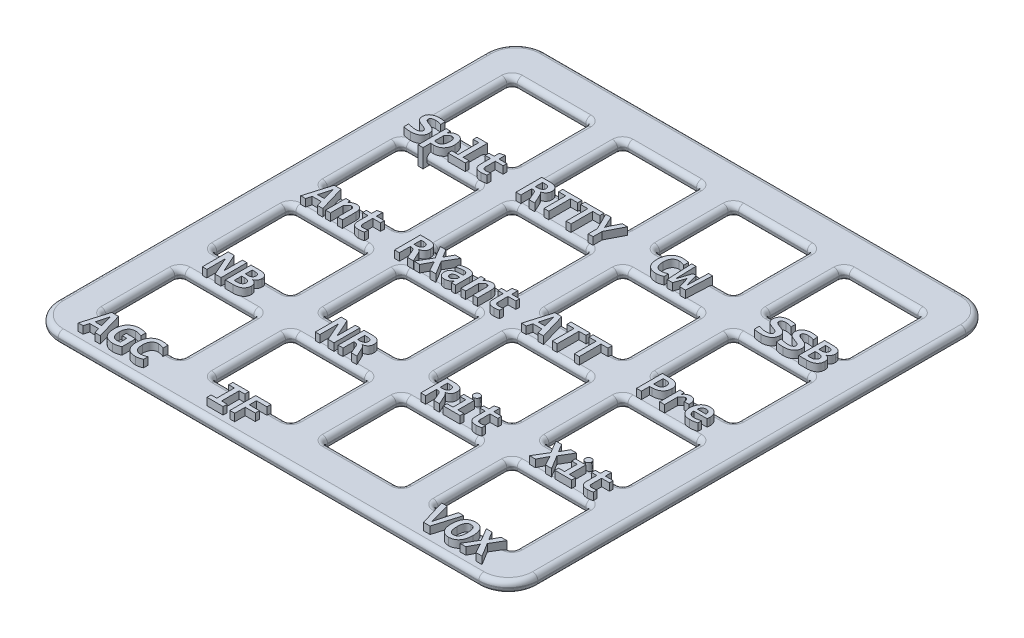
from build123d import *

# Parameters (mm, degrees)
MAIN_DEPTH                       = 1.5
SKETCH2_W                        = 10.7
SKETCH2_H                        = 10.7
BUTTON_HOLE_1_DEPTH              = 93.818144147
BUTTON_FILLET_R                  = 0.7
BUTTONS_BY_16_COUNT              = 4
BUTTONS_BY_16_PITCH              = 15
BUTTONS_BY_16_COUNT_DIR2         = 4
BUTTONS_BY_16_PITCH_DIR2         = 15
BUTTON_FILLET_OF_BUTTONS_BY_16_R = 0.7
OUTER_EDGE_FILLET_R              = 0.7
LETTERING_BOSS_DEPTH             = 2.5


with BuildPart() as part:
    # Sketch1 → main (new body)
    with BuildSketch(Plane(origin=(0, 0, 0), x_dir=(1, 0, 0), z_dir=(0, 1, 0))):
        with BuildLine():
            Line((-14.880741165, -14.535531583), (42.119258835, -14.535531583))
            ThreePointArc((42.119258835, -14.535531583), (44.94768596, -15.707104458), (46.119258835, -18.535531583))
            Line((46.119258835, -18.535531583), (46.119258835, -76.535531583))
            ThreePointArc((46.119258835, -76.535531583), (44.94768596, -79.363958708), (42.119258835, -80.535531583))
            Line((42.119258835, -80.535531583), (-14.880741165, -80.535531583))
            ThreePointArc((-14.880741165, -80.535531583), (-17.709168289, -79.363958708), (-18.880741165, -76.535531583))
            Line((-18.880741165, -76.535531583), (-18.880741165, -18.535531583))
            ThreePointArc((-18.880741165, -18.535531583), (-17.709168289, -15.707104458), (-14.880741165, -14.535531583))
        make_face()
    extrude(amount=MAIN_DEPTH)

    # Sketch2 → button hole 1 (cut, through all)
    with BuildSketch(Plane(origin=(0, 1.5, 0), x_dir=(1, 0, 0), z_dir=(0, 1, 0))):
        with Locations((-8.880741165, -25.035531583)):
            Rectangle(SKETCH2_W, SKETCH2_H)
    button_hole_1 = extrude(amount=-BUTTON_HOLE_1_DEPTH, mode=Mode.SUBTRACT)

    # button fillet
    button_fillet_edges = [part.edges().sort_by_distance(p)[0] for p in [
        (-8.880741165, 0, 30.385531583),
        (-8.880741165, 1.5, 30.385531583),
        (-8.880741165, 0, 19.685531583),
        (-8.880741165, 1.5, 19.685531583),
        (-3.530741165, 0.75, 30.385531583),
        (-3.530741165, 0, 25.035531583),
        (-3.530741165, 0.75, 19.685531583),
        (-3.530741165, 1.5, 25.035531583),
        (-14.230741165, 0.75, 19.685531583),
        (-14.230741165, 0, 25.035531583),
        (-14.230741165, 0.75, 30.385531583),
        (-14.230741165, 1.5, 25.035531583),
    ]]
    fillet(button_fillet_edges, radius=BUTTON_FILLET_R)

    # buttons by 16: button hole 1 4 × 4
    with Locations(*[(i * BUTTONS_BY_16_PITCH, 0, j * BUTTONS_BY_16_PITCH_DIR2) for i in range(BUTTONS_BY_16_COUNT) for j in range(BUTTONS_BY_16_COUNT_DIR2) if (i, j) != (0, 0)]):
        add(button_hole_1, mode=Mode.SUBTRACT)

    # button fillet of buttons by 16
    button_fillet_of_buttons_by_16_edges = [part.edges().sort_by_distance(p)[0] for p in [
        (-8.880741165, 0, 45.385531583),
        (-8.880741165, 1.5, 45.385531583),
        (-8.880741165, 0, 34.685531583),
        (-8.880741165, 1.5, 34.685531583),
        (-3.530741165, 0.75, 45.385531583),
        (-3.530741165, 0, 40.035531583),
        (-3.530741165, 0.75, 34.685531583),
        (-3.530741165, 1.5, 40.035531583),
        (-14.230741165, 0.75, 34.685531583),
        (-14.230741165, 0, 40.035531583),
        (-14.230741165, 0.75, 45.385531583),
        (-14.230741165, 1.5, 40.035531583),
        (-8.880741165, 0, 60.385531583),
        (-8.880741165, 1.5, 60.385531583),
        (-8.880741165, 0, 49.685531583),
        (-8.880741165, 1.5, 49.685531583),
        (-3.530741165, 0.75, 60.385531583),
        (-3.530741165, 0, 55.035531583),
        (-3.530741165, 0.75, 49.685531583),
        (-3.530741165, 1.5, 55.035531583),
        (-14.230741165, 0.75, 49.685531583),
        (-14.230741165, 0, 55.035531583),
        (-14.230741165, 0.75, 60.385531583),
        (-14.230741165, 1.5, 55.035531583),
        (-8.880741165, 0, 75.385531583),
        (-8.880741165, 1.5, 75.385531583),
        (-8.880741165, 0, 64.685531583),
        (-8.880741165, 1.5, 64.685531583),
        (-3.530741165, 0.75, 75.385531583),
        (-3.530741165, 0, 70.035531583),
        (-3.530741165, 0.75, 64.685531583),
        (-3.530741165, 1.5, 70.035531583),
        (-14.230741165, 0.75, 64.685531583),
        (-14.230741165, 0, 70.035531583),
        (-14.230741165, 0.75, 75.385531583),
        (-14.230741165, 1.5, 70.035531583),
        (6.119258835, 0, 30.385531583),
        (6.119258835, 1.5, 30.385531583),
        (6.119258835, 0, 19.685531583),
        (6.119258835, 1.5, 19.685531583),
        (11.469258835, 0.75, 30.385531583),
        (11.469258835, 0, 25.035531583),
        (11.469258835, 0.75, 19.685531583),
        (11.469258835, 1.5, 25.035531583),
        (0.769258835, 0.75, 19.685531583),
        (0.769258835, 0, 25.035531583),
        (0.769258835, 0.75, 30.385531583),
        (0.769258835, 1.5, 25.035531583),
        (6.119258835, 0, 45.385531583),
        (6.119258835, 1.5, 45.385531583),
        (6.119258835, 0, 34.685531583),
        (6.119258835, 1.5, 34.685531583),
        (11.469258835, 0.75, 45.385531583),
        (11.469258835, 0, 40.035531583),
        (11.469258835, 0.75, 34.685531583),
        (11.469258835, 1.5, 40.035531583),
        (0.769258835, 0.75, 34.685531583),
        (0.769258835, 0, 40.035531583),
        (0.769258835, 0.75, 45.385531583),
        (0.769258835, 1.5, 40.035531583),
        (6.119258835, 0, 60.385531583),
        (6.119258835, 1.5, 60.385531583),
        (6.119258835, 0, 49.685531583),
        (6.119258835, 1.5, 49.685531583),
        (11.469258835, 0.75, 60.385531583),
        (11.469258835, 0, 55.035531583),
        (11.469258835, 0.75, 49.685531583),
        (11.469258835, 1.5, 55.035531583),
        (0.769258835, 0.75, 49.685531583),
        (0.769258835, 0, 55.035531583),
        (0.769258835, 0.75, 60.385531583),
        (0.769258835, 1.5, 55.035531583),
        (6.119258835, 0, 75.385531583),
        (6.119258835, 1.5, 75.385531583),
        (6.119258835, 0, 64.685531583),
        (6.119258835, 1.5, 64.685531583),
        (11.469258835, 0.75, 75.385531583),
        (11.469258835, 0, 70.035531583),
        (11.469258835, 0.75, 64.685531583),
        (11.469258835, 1.5, 70.035531583),
        (0.769258835, 0.75, 64.685531583),
        (0.769258835, 0, 70.035531583),
        (0.769258835, 0.75, 75.385531583),
        (0.769258835, 1.5, 70.035531583),
        (21.119258835, 0, 30.385531583),
        (21.119258835, 1.5, 30.385531583),
        (21.119258835, 0, 19.685531583),
        (21.119258835, 1.5, 19.685531583),
        (26.469258835, 0.75, 30.385531583),
        (26.469258835, 0, 25.035531583),
        (26.469258835, 0.75, 19.685531583),
        (26.469258835, 1.5, 25.035531583),
        (15.769258835, 0.75, 19.685531583),
        (15.769258835, 0, 25.035531583),
        (15.769258835, 0.75, 30.385531583),
        (15.769258835, 1.5, 25.035531583),
        (21.119258835, 0, 45.385531583),
        (21.119258835, 1.5, 45.385531583),
        (21.119258835, 0, 34.685531583),
        (21.119258835, 1.5, 34.685531583),
        (26.469258835, 0.75, 45.385531583),
        (26.469258835, 0, 40.035531583),
        (26.469258835, 0.75, 34.685531583),
        (26.469258835, 1.5, 40.035531583),
        (15.769258835, 0.75, 34.685531583),
        (15.769258835, 0, 40.035531583),
        (15.769258835, 0.75, 45.385531583),
        (15.769258835, 1.5, 40.035531583),
        (21.119258835, 0, 60.385531583),
        (21.119258835, 1.5, 60.385531583),
        (21.119258835, 0, 49.685531583),
        (21.119258835, 1.5, 49.685531583),
        (26.469258835, 0.75, 60.385531583),
        (26.469258835, 0, 55.035531583),
        (26.469258835, 0.75, 49.685531583),
        (26.469258835, 1.5, 55.035531583),
        (15.769258835, 0.75, 49.685531583),
        (15.769258835, 0, 55.035531583),
        (15.769258835, 0.75, 60.385531583),
        (15.769258835, 1.5, 55.035531583),
        (21.119258835, 0, 75.385531583),
        (21.119258835, 1.5, 75.385531583),
        (21.119258835, 0, 64.685531583),
        (21.119258835, 1.5, 64.685531583),
        (26.469258835, 0.75, 75.385531583),
        (26.469258835, 0, 70.035531583),
        (26.469258835, 0.75, 64.685531583),
        (26.469258835, 1.5, 70.035531583),
        (15.769258835, 0.75, 64.685531583),
        (15.769258835, 0, 70.035531583),
        (15.769258835, 0.75, 75.385531583),
        (15.769258835, 1.5, 70.035531583),
        (36.119258835, 0, 30.385531583),
        (36.119258835, 1.5, 30.385531583),
        (36.119258835, 0, 19.685531583),
        (36.119258835, 1.5, 19.685531583),
        (41.469258835, 0.75, 30.385531583),
        (41.469258835, 0, 25.035531583),
        (41.469258835, 0.75, 19.685531583),
        (41.469258835, 1.5, 25.035531583),
        (30.769258835, 0.75, 19.685531583),
        (30.769258835, 0, 25.035531583),
        (30.769258835, 0.75, 30.385531583),
        (30.769258835, 1.5, 25.035531583),
        (36.119258835, 0, 45.385531583),
        (36.119258835, 1.5, 45.385531583),
        (36.119258835, 0, 34.685531583),
        (36.119258835, 1.5, 34.685531583),
        (41.469258835, 0.75, 45.385531583),
        (41.469258835, 0, 40.035531583),
        (41.469258835, 0.75, 34.685531583),
        (41.469258835, 1.5, 40.035531583),
        (30.769258835, 0.75, 34.685531583),
        (30.769258835, 0, 40.035531583),
        (30.769258835, 0.75, 45.385531583),
        (30.769258835, 1.5, 40.035531583),
        (36.119258835, 0, 60.385531583),
        (36.119258835, 1.5, 60.385531583),
        (36.119258835, 0, 49.685531583),
        (36.119258835, 1.5, 49.685531583),
        (41.469258835, 0.75, 60.385531583),
        (41.469258835, 0, 55.035531583),
        (41.469258835, 0.75, 49.685531583),
        (41.469258835, 1.5, 55.035531583),
        (30.769258835, 0.75, 49.685531583),
        (30.769258835, 0, 55.035531583),
        (30.769258835, 0.75, 60.385531583),
        (30.769258835, 1.5, 55.035531583),
        (36.119258835, 0, 75.385531583),
        (36.119258835, 1.5, 75.385531583),
        (36.119258835, 0, 64.685531583),
        (36.119258835, 1.5, 64.685531583),
        (41.469258835, 0.75, 75.385531583),
        (41.469258835, 0, 70.035531583),
        (41.469258835, 0.75, 64.685531583),
        (41.469258835, 1.5, 70.035531583),
        (30.769258835, 0.75, 64.685531583),
        (30.769258835, 0, 70.035531583),
        (30.769258835, 0.75, 75.385531583),
        (30.769258835, 1.5, 70.035531583),
    ]]
    fillet(button_fillet_of_buttons_by_16_edges, radius=BUTTON_FILLET_OF_BUTTONS_BY_16_R)

    # outer edge fillet
    outer_edge_fillet_edges = [part.edges().sort_by_distance(p)[0] for p in [
        (13.619258835, 1.5, 14.535531583),
        (13.619258835, 0, 14.535531583),
        (46.119258835, 1.5, 47.535531583),
        (46.119258835, 0, 47.535531583),
        (13.619258835, 1.5, 80.535531583),
        (13.619258835, 0, 80.535531583),
        (-18.880741165, 1.5, 47.535531583),
        (-18.880741165, 0, 47.535531583),
        (44.94768596, 1.5, 15.707104458),
        (44.94768596, 1.5, 79.363958708),
        (-17.709168289, 1.5, 79.363958708),
        (-17.709168289, 1.5, 15.707104458),
        (44.94768596, 0, 15.707104458),
        (44.94768596, 0, 79.363958708),
        (-17.709168289, 0, 79.363958708),
        (-17.709168289, 0, 15.707104458),
    ]]
    fillet(outer_edge_fillet_edges, radius=OUTER_EDGE_FILLET_R)

    # Lettering → lettering boss (add)
    # profile 1 of 47: a face of its own
    with BuildSketch(Plane(origin=(0, 0, 0), x_dir=(1, 0, 0), z_dir=(0, 1, 0))):
        with BuildLine():
            add(Edge.make_bspline(
                [(35.461192996, -33.072691909), (35.460219938, -33.118754507), (35.458330304, -33.208205957), (35.436683824, -33.337558753), (35.404146648, -33.458150303), (35.356871415, -33.569020514), (35.297849953, -33.670145601), (35.228271235, -33.762346077), (35.147849394, -33.84512241), (35.056676983, -33.918182679), (34.956202124, -33.982599991), (34.846563905, -34.03817851), (34.727356813, -34.083922022), (34.60014988, -34.121727685), (34.465263025, -34.150939713), (34.323804391, -34.171063334), (34.17615797, -34.184325826), (34.075541922, -34.185604497), (34.02425912, -34.186256221)],
                knots=[0, 0, 0, 0, 1.073681499, 2.085040185, 3.051149047, 3.981944283, 4.887978953, 5.776845786, 6.670466122, 7.573455289, 8.49677068, 9.450589821, 10.436166866, 11.471749255, 12.544173733, 13.653021529, 14.803772988, 16, 16, 16, 16], degree=3))
            add(Edge.make_bspline(
                [(34.02425912, -34.186256221), (33.933317541, -34.184576543), (33.753956378, -34.181263769), (33.48856806, -34.155083882), (33.228676809, -34.108055718), (33.060379735, -34.058846435), (32.97568575, -34.034082307)],
                knots=[0, 0, 0, 0, 1.025764599, 2.023082686, 3.005134181, 4, 4, 4, 4], degree=3))
            Line((32.97568575, -34.034082307), (32.97568575, -33.374662018))
            add(Edge.make_bspline(
                [(32.97568575, -33.374662018), (33.018439663, -33.388274658), (33.105246895, -33.415913665), (33.237527488, -33.455161652), (33.373409396, -33.488440968), (33.51010859, -33.519067388), (33.647120187, -33.54339105), (33.783175795, -33.562708611), (33.917032304, -33.575143008), (34.005476579, -33.576765352), (34.048828866, -33.577560568)],
                knots=[0, 0, 0, 0, 0.982138956, 1.994127776, 3.019379675, 4.043652595, 5.060010385, 6.064286964, 7.051181246, 8, 8, 8, 8], degree=3))
            add(Edge.make_bspline(
                [(34.048828866, -33.577560568), (34.079483437, -33.577344081), (34.138206785, -33.576929368), (34.222883387, -33.571371353), (34.300112613, -33.561920475), (34.370914891, -33.549490037), (34.434595377, -33.532763313), (34.492509693, -33.513882948), (34.54389405, -33.491729123), (34.589828685, -33.467217621), (34.629193063, -33.439492495), (34.663478373, -33.409932443), (34.69132107, -33.377177044), (34.720998052, -33.330630302), (34.745804733, -33.265164811), (34.74928272, -33.210044658), (34.751048069, -33.182066909)],
                knots=[0, 0, 0, 0, 1.428616996, 2.73672639, 3.952495327, 5.053878092, 6.0842745, 7.018828766, 7.890331589, 8.689308687, 9.440856164, 10.130100935, 10.793906804, 11.436117796, 12.698631087, 14, 14, 14, 14], degree=3))
            add(Edge.make_bspline(
                [(34.751048069, -33.182066909), (34.750093692, -33.161661255), (34.748237167, -33.121966637), (34.734977728, -33.064648206), (34.71040196, -33.013113569), (34.677322971, -32.966756363), (34.636551645, -32.924783594), (34.59117636, -32.883974108), (34.53783873, -32.848048065), (34.459156631, -32.800395294), (34.347847102, -32.747085562), (34.201586397, -32.693270589), (34.046689287, -32.638936463), (33.887415467, -32.581490004), (33.728896916, -32.515390595), (33.597775581, -32.456259305), (33.496922977, -32.401704077), (33.425727716, -32.355764053), (33.358644273, -32.305232749), (33.294998405, -32.251068159), (33.236891983, -32.190722285), (33.185463063, -32.12446183), (33.138954468, -32.053357109), (33.09830093, -31.976509382), (33.065054636, -31.892254134), (33.042671403, -31.799998883), (33.02904602, -31.699835006), (33.027310942, -31.630520469), (33.026410388, -31.594544264)],
                knots=[0, 0, 0, 0, 0.628577789, 1.222756944, 1.798018064, 2.376093337, 2.969100815, 3.597678604, 4.252424917, 4.946124793, 6.431204757, 8.043936516, 9.745465074, 11.488681512, 13.25853968, 15.035457213, 15.916880054, 16.788288763, 17.642849837, 18.502665518, 19.360321436, 20.218324825, 21.082903639, 21.974822425, 22.892221362, 23.865363472, 24.892063288, 26, 26, 26, 26], degree=3))
            add(Edge.make_bspline(
                [(33.026410388, -31.594544264), (33.027274108, -31.560670177), (33.0289824, -31.493673001), (33.04415211, -31.394792401), (33.066631419, -31.298171014), (33.100120009, -31.205000982), (33.142627892, -31.115346769), (33.197269293, -31.031893245), (33.261663821, -30.95351691), (33.337769728, -30.881972697), (33.424562998, -30.816652376), (33.523012291, -30.75903275), (33.631968598, -30.707026656), (33.753180736, -30.663973457), (33.886225231, -30.62760361), (34.032541014, -30.603386426), (34.19163711, -30.586761566), (34.302140038, -30.585474986), (34.359517272, -30.584806945)],
                knots=[0, 0, 0, 0, 0.86106195, 1.703033948, 2.539139973, 3.380790137, 4.216301896, 5.056905248, 5.911254958, 6.790607679, 7.707171391, 8.668295362, 9.687250551, 10.773449095, 11.935660323, 13.190638171, 14.54127474, 16, 16, 16, 16], degree=3))
            add(Edge.make_bspline(
                [(34.359517272, -30.584806945), (34.395192595, -30.585328122), (34.468179527, -30.586394381), (34.578896885, -30.593192523), (34.69124805, -30.602352865), (34.802717558, -30.615291702), (34.911655597, -30.62997727), (35.01615136, -30.647768483), (35.114685419, -30.665116669), (35.177500591, -30.67941277), (35.207569808, -30.686256221)],
                knots=[0, 0, 0, 0, 1.000632186, 2.047159369, 3.110551158, 4.162103459, 5.194366354, 6.193323381, 7.135155576, 8, 8, 8, 8], degree=3))
            Line((35.207569808, -30.686256221), (35.207569808, -31.294951873))
            add(Edge.make_bspline(
                [(35.207569808, -31.294951873), (35.17755424, -31.284076418), (35.115389321, -31.261552381), (35.017882443, -31.233039217), (34.914896829, -31.206571669), (34.807944602, -31.184965323), (34.698833511, -31.166419449), (34.589839247, -31.153504356), (34.483329743, -31.143838304), (34.413432739, -31.143125648), (34.379331583, -31.14277796)],
                knots=[0, 0, 0, 0, 0.905300762, 1.874958649, 2.879989676, 3.920459461, 4.968805495, 6.018141936, 7.033096622, 8, 8, 8, 8], degree=3))
            add(Edge.make_bspline(
                [(34.379331583, -31.14277796), (34.351314338, -31.142973959), (34.297332983, -31.143351593), (34.219861571, -31.149221763), (34.14880624, -31.157352156), (34.084645979, -31.170438094), (34.026198867, -31.185096368), (33.973856888, -31.20350348), (33.926411551, -31.223964621), (33.884590384, -31.247790061), (33.847391354, -31.273528612), (33.817014432, -31.303956514), (33.790458948, -31.335782043), (33.764272916, -31.383308933), (33.741009556, -31.448817433), (33.738068433, -31.504220459), (33.736555315, -31.532723612)],
                knots=[0, 0, 0, 0, 1.388230333, 2.674729552, 3.848979118, 4.930101904, 5.917823404, 6.833012122, 7.677256906, 8.474713018, 9.216010271, 9.910495862, 10.599653, 11.262301414, 12.591538262, 14, 14, 14, 14], degree=3))
            add(Edge.make_bspline(
                [(33.736555315, -31.532723612), (33.737455619, -31.550519959), (33.739203448, -31.585069351), (33.753342619, -31.634928436), (33.77654148, -31.680867781), (33.809977093, -31.722004976), (33.850319289, -31.760011163), (33.896270924, -31.796655217), (33.94898437, -31.830353208), (34.028107231, -31.87474687), (34.139650508, -31.92480093), (34.284653433, -31.981066224), (34.44056414, -32.034816895), (34.599699077, -32.095990815), (34.759872573, -32.161027453), (34.889713197, -32.224533677), (34.9907355, -32.279743737), (35.061879067, -32.32656744), (35.129020188, -32.377817306), (35.192166921, -32.432762858), (35.25066594, -32.492554967), (35.303221834, -32.557665228), (35.349075684, -32.628483676), (35.389232061, -32.704335812), (35.422153956, -32.786142297), (35.445100252, -32.875348129), (35.458456558, -32.971628224), (35.46026189, -33.03830377), (35.461192996, -33.072691909)],
                knots=[0, 0, 0, 0, 0.557156268, 1.081649532, 1.611348813, 2.159818371, 2.733894156, 3.347031838, 3.999468898, 4.692937397, 6.19005387, 7.82657883, 9.568786128, 11.359307707, 13.171290529, 14.986394118, 15.88741221, 16.778746798, 17.653416553, 18.53387112, 19.400741367, 20.27258301, 21.152453011, 22.041629961, 22.959843454, 23.910073311, 24.922113205, 26, 26, 26, 26], degree=3))
        make_face()
    # profile 2 of 47: a face of its own
    with BuildSketch(Plane(origin=(0, 0, 0), x_dir=(1, 0, 0), z_dir=(0, 1, 0))):
        with BuildLine():
            add(Edge.make_bspline(
                [(38.45394662, -33.072691909), (38.452973561, -33.118754507), (38.451083927, -33.208205957), (38.429437447, -33.337558753), (38.396900271, -33.458150303), (38.349625038, -33.569020514), (38.290603576, -33.670145601), (38.221024858, -33.762346077), (38.140603017, -33.84512241), (38.049430606, -33.918182679), (37.948955747, -33.982599991), (37.839317528, -34.03817851), (37.720110436, -34.083922022), (37.592903503, -34.121727685), (37.458016648, -34.150939713), (37.316558014, -34.171063334), (37.168911593, -34.184325826), (37.068295545, -34.185604497), (37.017012743, -34.186256221)],
                knots=[0, 0, 0, 0, 1.073681499, 2.085040185, 3.051149047, 3.981944283, 4.887978953, 5.776845786, 6.670466122, 7.573455289, 8.49677068, 9.450589821, 10.436166866, 11.471749255, 12.544173733, 13.653021529, 14.803772988, 16, 16, 16, 16], degree=3))
            add(Edge.make_bspline(
                [(37.017012743, -34.186256221), (36.926071164, -34.184576543), (36.746710001, -34.181263769), (36.481321683, -34.155083882), (36.221430432, -34.108055718), (36.053133358, -34.058846435), (35.968439373, -34.034082307)],
                knots=[0, 0, 0, 0, 1.025764599, 2.023082686, 3.005134181, 4, 4, 4, 4], degree=3))
            Line((35.968439373, -34.034082307), (35.968439373, -33.374662018))
            add(Edge.make_bspline(
                [(35.968439373, -33.374662018), (36.011193286, -33.388274658), (36.098000518, -33.415913665), (36.230281112, -33.455161652), (36.366163019, -33.488440968), (36.502862214, -33.519067388), (36.63987381, -33.54339105), (36.775929418, -33.562708611), (36.909785927, -33.575143008), (36.998230202, -33.576765352), (37.041582489, -33.577560568)],
                knots=[0, 0, 0, 0, 0.982138956, 1.994127776, 3.019379675, 4.043652595, 5.060010385, 6.064286964, 7.051181246, 8, 8, 8, 8], degree=3))
            add(Edge.make_bspline(
                [(37.041582489, -33.577560568), (37.07223706, -33.577344081), (37.130960408, -33.576929368), (37.215637011, -33.571371353), (37.292866237, -33.561920475), (37.363668514, -33.549490037), (37.427349, -33.532763313), (37.485263316, -33.513882948), (37.536647673, -33.491729123), (37.582582308, -33.467217621), (37.621946686, -33.439492495), (37.656231997, -33.409932443), (37.684074693, -33.377177044), (37.713751675, -33.330630302), (37.738558356, -33.265164811), (37.742036344, -33.210044658), (37.743801692, -33.182066909)],
                knots=[0, 0, 0, 0, 1.428616996, 2.73672639, 3.952495327, 5.053878092, 6.0842745, 7.018828766, 7.890331589, 8.689308687, 9.440856164, 10.130100935, 10.793906804, 11.436117796, 12.698631087, 14, 14, 14, 14], degree=3))
            add(Edge.make_bspline(
                [(37.743801692, -33.182066909), (37.742847315, -33.161661255), (37.74099079, -33.121966637), (37.727731351, -33.064648206), (37.703155584, -33.013113569), (37.670076594, -32.966756363), (37.629305268, -32.924783594), (37.583929984, -32.883974108), (37.530592353, -32.848048065), (37.451910254, -32.800395294), (37.340600725, -32.747085562), (37.194340021, -32.693270589), (37.03944291, -32.638936463), (36.880169091, -32.581490004), (36.721650539, -32.515390595), (36.590529204, -32.456259305), (36.4896766, -32.401704077), (36.41848134, -32.355764053), (36.351397896, -32.305232749), (36.287752028, -32.251068159), (36.229645607, -32.190722285), (36.178216686, -32.12446183), (36.131708091, -32.053357109), (36.091054553, -31.976509382), (36.057808259, -31.892254134), (36.035425026, -31.799998883), (36.021799643, -31.699835006), (36.020064565, -31.630520469), (36.019164011, -31.594544264)],
                knots=[0, 0, 0, 0, 0.628577789, 1.222756944, 1.798018064, 2.376093337, 2.969100815, 3.597678604, 4.252424917, 4.946124793, 6.431204757, 8.043936516, 9.745465074, 11.488681512, 13.25853968, 15.035457213, 15.916880054, 16.788288763, 17.642849837, 18.502665518, 19.360321436, 20.218324825, 21.082903639, 21.974822425, 22.892221362, 23.865363472, 24.892063288, 26, 26, 26, 26], degree=3))
            add(Edge.make_bspline(
                [(36.019164011, -31.594544264), (36.020027731, -31.560670177), (36.021736023, -31.493673001), (36.036905733, -31.394792401), (36.059385043, -31.298171014), (36.092873632, -31.205000982), (36.135381515, -31.115346769), (36.190022916, -31.031893245), (36.254417445, -30.95351691), (36.330523351, -30.881972697), (36.417316621, -30.816652376), (36.515765914, -30.75903275), (36.624722222, -30.707026656), (36.745934359, -30.663973457), (36.878978854, -30.62760361), (37.025294637, -30.603386426), (37.184390733, -30.586761566), (37.294893661, -30.585474986), (37.352270895, -30.584806945)],
                knots=[0, 0, 0, 0, 0.86106195, 1.703033948, 2.539139973, 3.380790137, 4.216301896, 5.056905248, 5.911254958, 6.790607679, 7.707171391, 8.668295362, 9.687250551, 10.773449095, 11.935660323, 13.190638171, 14.54127474, 16, 16, 16, 16], degree=3))
            add(Edge.make_bspline(
                [(37.352270895, -30.584806945), (37.387946219, -30.585328122), (37.460933151, -30.586394381), (37.571650508, -30.593192523), (37.684001673, -30.602352865), (37.795471181, -30.615291702), (37.90440922, -30.62997727), (38.008904983, -30.647768483), (38.107439042, -30.665116669), (38.170254214, -30.67941277), (38.200323431, -30.686256221)],
                knots=[0, 0, 0, 0, 1.000632186, 2.047159369, 3.110551158, 4.162103459, 5.194366354, 6.193323381, 7.135155576, 8, 8, 8, 8], degree=3))
            Line((38.200323431, -30.686256221), (38.200323431, -31.294951873))
            add(Edge.make_bspline(
                [(38.200323431, -31.294951873), (38.170307863, -31.284076418), (38.108142944, -31.261552381), (38.010636066, -31.233039217), (37.907650453, -31.206571669), (37.800698225, -31.184965323), (37.691587134, -31.166419449), (37.582592871, -31.153504356), (37.476083366, -31.143838304), (37.406186362, -31.143125648), (37.372085206, -31.14277796)],
                knots=[0, 0, 0, 0, 0.905300762, 1.874958649, 2.879989676, 3.920459461, 4.968805495, 6.018141936, 7.033096622, 8, 8, 8, 8], degree=3))
            add(Edge.make_bspline(
                [(37.372085206, -31.14277796), (37.344067961, -31.142973959), (37.290086606, -31.143351593), (37.212615194, -31.149221763), (37.141559863, -31.157352156), (37.077399603, -31.170438094), (37.018952491, -31.185096368), (36.966610512, -31.20350348), (36.919165174, -31.223964621), (36.877344007, -31.247790061), (36.840144977, -31.273528612), (36.809768055, -31.303956514), (36.783212571, -31.335782043), (36.75702654, -31.383308933), (36.733763179, -31.448817433), (36.730822056, -31.504220459), (36.729308938, -31.532723612)],
                knots=[0, 0, 0, 0, 1.388230333, 2.674729552, 3.848979118, 4.930101904, 5.917823404, 6.833012122, 7.677256906, 8.474713018, 9.216010271, 9.910495862, 10.599653, 11.262301414, 12.591538262, 14, 14, 14, 14], degree=3))
            add(Edge.make_bspline(
                [(36.729308938, -31.532723612), (36.730209243, -31.550519959), (36.731957071, -31.585069351), (36.746096242, -31.634928436), (36.769295103, -31.680867781), (36.802730716, -31.722004976), (36.843072912, -31.760011163), (36.889024547, -31.796655217), (36.941737994, -31.830353208), (37.020860854, -31.87474687), (37.132404131, -31.92480093), (37.277407056, -31.981066224), (37.433317763, -32.034816895), (37.5924527, -32.095990815), (37.752626196, -32.161027453), (37.88246682, -32.224533677), (37.983489123, -32.279743737), (38.05463269, -32.32656744), (38.121773811, -32.377817306), (38.184920545, -32.432762858), (38.243419563, -32.492554967), (38.295975457, -32.557665228), (38.341829308, -32.628483676), (38.381985684, -32.704335812), (38.414907579, -32.786142297), (38.437853875, -32.875348129), (38.451210181, -32.971628224), (38.453015513, -33.03830377), (38.45394662, -33.072691909)],
                knots=[0, 0, 0, 0, 0.557156268, 1.081649532, 1.611348813, 2.159818371, 2.733894156, 3.347031838, 3.999468898, 4.692937397, 6.19005387, 7.82657883, 9.568786128, 11.359307707, 13.171290529, 14.986394118, 15.88741221, 16.778746798, 17.653416553, 18.53387112, 19.400741367, 20.27258301, 21.152453011, 22.041629961, 22.959843454, 23.910073311, 24.922113205, 26, 26, 26, 26], degree=3))
        make_face()
    # profile 3 of 47: a face of its own
    with BuildSketch(Plane(origin=(0, 0, 0), x_dir=(1, 0, 0), z_dir=(0, 1, 0))):
        with BuildLine():
            Line((39.062642272, -34.135531583), (39.062642272, -30.635531583))
            Line((39.062642272, -30.635531583), (40.196813467, -30.635531583))
            add(Edge.make_bspline(
                [(40.196813467, -30.635531583), (40.245178192, -30.636098997), (40.339100088, -30.637200886), (40.475072573, -30.646831719), (40.601988486, -30.662103475), (40.719094589, -30.685470439), (40.827637444, -30.713092876), (40.926127576, -30.749469373), (41.016418561, -30.789675513), (41.096258805, -30.838884443), (41.167381398, -30.893170298), (41.228583951, -30.955192176), (41.279894106, -31.023765881), (41.324008733, -31.098126161), (41.35584414, -31.180270745), (41.378838044, -31.268578041), (41.393476313, -31.363157751), (41.395127413, -31.428577606), (41.395975605, -31.462184663)],
                knots=[0, 0, 0, 0, 1.402020869, 2.722654989, 3.950110139, 5.105271457, 6.182839017, 7.193223738, 8.145991228, 9.043198014, 9.905766409, 10.734443583, 11.560141935, 12.38384842, 13.232981204, 14.104313047, 15.026160196, 16, 16, 16, 16], degree=3))
            add(Edge.make_bspline(
                [(41.395975605, -31.462184663), (41.394372626, -31.504813464), (41.391183109, -31.58963387), (41.368095766, -31.714076062), (41.328733885, -31.83209865), (41.272052643, -31.94074928), (41.199153957, -32.038790152), (41.124952646, -32.109755322), (41.057732342, -32.158978767), (41.002853054, -32.192666373), (40.943155755, -32.221083099), (40.901274304, -32.236583879), (40.880010931, -32.244453684)],
                knots=[0, 0, 0, 0, 1.273298406, 2.533538006, 3.766639183, 4.977638108, 6.179029059, 7.401702507, 8.028476186, 8.666091093, 9.322769338, 10, 10, 10, 10], degree=3))
            add(Edge.make_bspline(
                [(40.880010931, -32.244453684), (40.924092927, -32.253415804), (41.012836537, -32.271457884), (41.116554626, -32.318521271), (41.195993826, -32.362677478), (41.250483299, -32.403312963), (41.302800019, -32.446555681), (41.349864078, -32.496071487), (41.393939622, -32.54913733), (41.432746479, -32.607005498), (41.46625352, -32.669844968), (41.495445454, -32.736781767), (41.519493225, -32.807971431), (41.535981335, -32.883719883), (41.546598448, -32.963276751), (41.547627121, -33.017969474), (41.548149518, -33.045744445)],
                knots=[0, 0, 0, 0, 1.6519262, 3.32557291, 4.166740498, 4.995835318, 5.824301884, 6.663779587, 7.507195088, 8.362647254, 9.224604015, 10.126598034, 11.049652309, 11.986803716, 12.977625078, 14, 14, 14, 14], degree=3))
            add(Edge.make_bspline(
                [(41.548149518, -33.045744445), (41.54724251, -33.089669343), (41.545475463, -33.175244507), (41.527219579, -33.299103252), (41.500235564, -33.414986027), (41.460524003, -33.522200043), (41.408203846, -33.620157753), (41.346450718, -33.710946587), (41.271624649, -33.792076902), (41.186413706, -33.865448196), (41.090213209, -33.929637807), (40.983367952, -33.984086709), (40.867860841, -34.032123105), (40.741482345, -34.069455019), (40.605764744, -34.100136652), (40.459303344, -34.119394737), (40.303309725, -34.133966189), (40.195795086, -34.135000187), (40.140540822, -34.135531583)],
                knots=[0, 0, 0, 0, 1.039371005, 2.024918617, 2.958047709, 3.852767572, 4.723053758, 5.582001921, 6.445494094, 7.328259018, 8.239147345, 9.176460892, 10.16391264, 11.196919877, 12.292741297, 13.455226912, 14.692182175, 16, 16, 16, 16], degree=3))
            Line((40.140540822, -34.135531583), (39.062642272, -34.135531583))
        make_face()
        with BuildLine():
            add(Edge.make_bspline(
                [(40.685830677, -31.569974518), (40.684401154, -31.53891651), (40.681630525, -31.478721492), (40.661354014, -31.40650229), (40.636751108, -31.35504987), (40.614243654, -31.319357793), (40.586631643, -31.286895266), (40.55329766, -31.258265835), (40.516045453, -31.231922328), (40.473677339, -31.209016138), (40.42646163, -31.189043088), (40.374106158, -31.172754776), (40.316716069, -31.158972472), (40.253562026, -31.150014365), (40.184810704, -31.143134329), (40.136862043, -31.14289962), (40.112008214, -31.14277796)],
                knots=[0, 0, 0, 0, 1.599357931, 3.099792517, 3.824733362, 4.535069213, 5.269290696, 6.012427379, 6.794603599, 7.61746315, 8.490210935, 9.433542011, 10.441150938, 11.529478764, 12.719423833, 14, 14, 14, 14], degree=3))
            Line((40.112008214, -31.14277796), (39.722062562, -31.14277796))
            Line((39.722062562, -31.14277796), (39.722062562, -32.055821438))
            Line((39.722062562, -32.055821438), (40.112008214, -32.055821438))
            add(Edge.make_bspline(
                [(40.112008214, -32.055821438), (40.137388214, -32.055404031), (40.18614316, -32.054602193), (40.256124072, -32.047461043), (40.319811536, -32.03577893), (40.377580771, -32.019327924), (40.429376677, -31.997195067), (40.47683517, -31.973436582), (40.518959181, -31.944934479), (40.567874298, -31.903296933), (40.619272464, -31.843207997), (40.658512558, -31.758164879), (40.682381985, -31.666409386), (40.684663132, -31.602622272), (40.685830677, -31.569974518)],
                knots=[0, 0, 0, 0, 1.069032976, 2.053610886, 2.959553848, 3.794328356, 4.577732592, 5.329421169, 6.02708937, 6.714020821, 8.033657071, 9.318040837, 10.627309837, 12, 12, 12, 12], degree=3))
        make_face(mode=Mode.SUBTRACT)
        with BuildLine():
            add(Edge.make_bspline(
                [(40.188887743, -33.577560568), (40.214801479, -33.577203479), (40.265174226, -33.576509345), (40.338027559, -33.568323342), (40.405891039, -33.55576795), (40.468842809, -33.538479154), (40.526992632, -33.515934067), (40.580508564, -33.490326919), (40.629195694, -33.460415626), (40.672572093, -33.426662532), (40.710771693, -33.388674303), (40.745390638, -33.348885563), (40.772948616, -33.304198454), (40.804819509, -33.242290728), (40.832504086, -33.157291725), (40.836155512, -33.086399595), (40.838004591, -33.05049988)],
                knots=[0, 0, 0, 0, 1.157126176, 2.249294499, 3.270071966, 4.237898203, 5.160636285, 6.052674293, 6.8846023, 7.708539307, 8.501376315, 9.288660001, 10.058048539, 10.83920472, 12.39937595, 14, 14, 14, 14], degree=3))
            add(Edge.make_bspline(
                [(40.838004591, -33.05049988), (40.837696432, -33.031968549), (40.837089646, -32.99547911), (40.827939928, -32.942633519), (40.814228554, -32.892820439), (40.796655056, -32.845632876), (40.771137989, -32.802446933), (40.741379616, -32.762050568), (40.705614355, -32.725184849), (40.665370695, -32.690907383), (40.618938827, -32.660780568), (40.567080937, -32.634625862), (40.509481305, -32.612351485), (40.446022729, -32.594385533), (40.376866619, -32.580281051), (40.302239757, -32.569844032), (40.221717044, -32.56476284), (40.166172712, -32.563646623), (40.137370533, -32.563067815)],
                knots=[0, 0, 0, 0, 0.919965197, 1.811473402, 2.655599999, 3.487070925, 4.30463685, 5.139728507, 5.975542427, 6.851443155, 7.761895275, 8.719057734, 9.733411133, 10.826385967, 11.992916024, 13.238912289, 14.568254558, 16, 16, 16, 16], degree=3))
            Line((40.137370533, -32.563067815), (39.722062562, -32.563067815))
            Line((39.722062562, -32.563067815), (39.722062562, -33.577560568))
            Line((39.722062562, -33.577560568), (40.188887743, -33.577560568))
        make_face(mode=Mode.SUBTRACT)
    # profile 4 of 47: a face of its own
    with BuildSketch(Plane(origin=(0, 0, 0), x_dir=(1, 0, 0), z_dir=(0, 1, 0))):
        with BuildLine():
            add(Edge.make_bspline(
                [(20.683022998, -33.98335767), (20.644344593, -33.999868979), (20.56845875, -34.032263661), (20.453757445, -34.073336527), (20.341149602, -34.10843205), (20.22956009, -34.137142629), (20.117762325, -34.16000966), (20.004332408, -34.174309587), (19.888788688, -34.18457964), (19.810952743, -34.185692878), (19.771564665, -34.186256221)],
                knots=[0, 0, 0, 0, 1.072602722, 2.104413604, 3.106297595, 4.08050826, 5.042709706, 6.014913564, 6.995467464, 8, 8, 8, 8], degree=3))
            add(Edge.make_bspline(
                [(19.771564665, -34.186256221), (19.709948868, -34.184907641), (19.590318655, -34.182289304), (19.416008642, -34.161399055), (19.252782507, -34.12688717), (19.10006212, -34.078707515), (18.958979186, -34.015755291), (18.828863324, -33.939328253), (18.709959845, -33.849409306), (18.603093157, -33.745510599), (18.508075732, -33.628355027), (18.426458552, -33.496887198), (18.355692924, -33.353148583), (18.29787363, -33.195849632), (18.252882455, -33.025452953), (18.221003442, -32.841961732), (18.200623164, -32.645426133), (18.198572711, -32.510018474), (18.197515752, -32.440219083)],
                knots=[0, 0, 0, 0, 1.102605573, 2.140764961, 3.136846793, 4.08496906, 5.001529512, 5.896051515, 6.780328523, 7.66316301, 8.557497515, 9.473264751, 10.427030373, 11.420482266, 12.467702166, 13.577100782, 14.751053738, 16, 16, 16, 16], degree=3))
            add(Edge.make_bspline(
                [(18.197515752, -32.440219083), (18.198783847, -32.368561784), (18.201255829, -32.228875517), (18.223358144, -32.025732982), (18.25721583, -31.834280241), (18.307671315, -31.65578873), (18.36973496, -31.489380197), (18.445512339, -31.33680413), (18.531816763, -31.196660539), (18.631563823, -31.070857498), (18.742794438, -30.958455631), (18.86595181, -30.860487848), (18.999533733, -30.775752253), (19.14505048, -30.706765455), (19.300510023, -30.652316644), (19.465533996, -30.612307057), (19.640142183, -30.589378299), (19.759609228, -30.586353708), (19.820704157, -30.584806945)],
                knots=[0, 0, 0, 0, 1.232307787, 2.402218284, 3.511138658, 4.573037126, 5.588482404, 6.562047137, 7.499038646, 8.414657469, 9.317692522, 10.213424542, 11.116219401, 12.033010505, 12.977368732, 13.94518829, 14.949178196, 16, 16, 16, 16], degree=3))
            add(Edge.make_bspline(
                [(19.820704157, -30.584806945), (19.859811462, -30.584771481), (19.935670839, -30.584702689), (20.046605071, -30.58955373), (20.153006653, -30.593866944), (20.257022093, -30.605268123), (20.360855331, -30.617806106), (20.465735271, -30.637407206), (20.573822081, -30.657497818), (20.646140976, -30.676543225), (20.683022998, -30.686256221)],
                knots=[0, 0, 0, 0, 1.077376558, 2.089868288, 3.059369192, 4.010411707, 4.972009834, 5.940198088, 6.949518525, 8, 8, 8, 8], degree=3))
            Line((20.683022998, -30.686256221), (20.683022998, -31.34567651))
            add(Edge.make_bspline(
                [(20.683022998, -31.34567651), (20.645169117, -31.328318002), (20.571045582, -31.294327459), (20.458847221, -31.251964), (20.349938106, -31.215546423), (20.243424363, -31.189237753), (20.141386918, -31.168277684), (20.043446045, -31.154135256), (19.950331856, -31.144940414), (19.889677311, -31.143483036), (19.860332781, -31.14277796)],
                knots=[0, 0, 0, 0, 1.170030163, 2.291093263, 3.368831198, 4.395296508, 5.372370687, 6.295361994, 7.175300008, 8, 8, 8, 8], degree=3))
            add(Edge.make_bspline(
                [(19.860332781, -31.14277796), (19.819588776, -31.143773111), (19.740906188, -31.145694894), (19.627272008, -31.162411392), (19.522838591, -31.190690853), (19.42773244, -31.230749151), (19.341165712, -31.280539149), (19.262149971, -31.339086633), (19.192098451, -31.408090924), (19.13008513, -31.485375426), (19.075865669, -31.571100024), (19.029336386, -31.664636258), (18.990260939, -31.765983941), (18.959933864, -31.87467329), (18.936141502, -31.989619717), (18.91998645, -32.110411645), (18.909153012, -32.236593926), (18.908164718, -32.322630428), (18.907660679, -32.366509844)],
                knots=[0, 0, 0, 0, 1.109729706, 2.143049175, 3.121026665, 4.050204485, 4.946654748, 5.836403406, 6.722153568, 7.618170183, 8.530804457, 9.480502004, 10.460411604, 11.48580219, 12.551706219, 13.656287425, 14.804684813, 16, 16, 16, 16], degree=3))
            add(Edge.make_bspline(
                [(18.907660679, -32.366509844), (18.90805791, -32.412774675), (18.908833181, -32.503069301), (18.920974818, -32.634442086), (18.936547561, -32.75882762), (18.961281122, -32.875077473), (18.992451203, -32.98354379), (19.03252893, -33.083102357), (19.07892237, -33.174911069), (19.13399907, -33.257869056), (19.196711102, -33.332485576), (19.26859623, -33.396724363), (19.348120659, -33.452151302), (19.43574358, -33.498482626), (19.532294738, -33.534034219), (19.637139425, -33.558969055), (19.750168777, -33.575526154), (19.828567347, -33.576867777), (19.869051078, -33.577560568)],
                knots=[0, 0, 0, 0, 1.256876421, 2.453033611, 3.583260076, 4.661975506, 5.679853963, 6.646528144, 7.574590913, 8.470745685, 9.346915849, 10.216322401, 11.082788599, 11.975686973, 12.902638023, 13.870910894, 14.900573425, 16, 16, 16, 16], degree=3))
            add(Edge.make_bspline(
                [(19.869051078, -33.577560568), (19.900265907, -33.57679947), (19.965311565, -33.575213489), (20.06556789, -33.561416575), (20.169891635, -33.541733995), (20.276556986, -33.51722936), (20.382851927, -33.487242028), (20.487425794, -33.452464205), (20.587590221, -33.415072967), (20.65193668, -33.387825499), (20.683022998, -33.374662018)],
                knots=[0, 0, 0, 0, 0.887372101, 1.849111607, 2.873273884, 3.906654629, 4.960374994, 6.012916101, 7.040022999, 8, 8, 8, 8], degree=3))
            Line((20.683022998, -33.374662018), (20.683022998, -33.98335767))
        make_face()
    # profile 5 of 47: a face of its own
    with BuildSketch(Plane(origin=(0, 0, 0), x_dir=(1, 0, 0), z_dir=(0, 1, 0))):
        Polygon((23.726501259, -34.135531583), (22.952950534, -34.135531583), (22.608974085, -33.020382126), (22.483747636, -32.566238105), (22.352180607, -33.031478141), (21.982049266, -34.135531583), (21.240994013, -34.135531583), (21.063457781, -30.635531583), (21.644413397, -30.635531583), (21.712574628, -32.879304228), (21.730011223, -33.492755315), (21.900414302, -32.964902054), (22.315722273, -31.700748974), (22.730237672, -31.700748974), (23.135242201, -33.059218177), (23.266016657, -33.487207307), (23.274734955, -32.94112488), (23.345273904, -30.635531583), (23.904037491, -30.635531583), align=None)
    # profile 6 of 47: a face of its own
    with BuildSketch(Plane(origin=(0, 0, 0), x_dir=(1, 0, 0), z_dir=(0, 1, 0))):
        with BuildLine():
            Line((2.531062969, -34.135531583), (2.042045759, -32.993434663))
            add(Edge.make_bspline(
                [(2.042045759, -32.993434663), (2.030145098, -32.967381026), (2.007019836, -32.916753825), (1.960214442, -32.849710398), (1.906816233, -32.792427406), (1.84564902, -32.74615645), (1.778687404, -32.709393609), (1.705544755, -32.682771312), (1.626536942, -32.667993056), (1.572108906, -32.665692222), (1.544310252, -32.66451709)],
                knots=[0, 0, 0, 0, 1.07937985, 2.097441539, 3.071055259, 4.024539089, 4.97969058, 5.945096662, 6.95047571, 8, 8, 8, 8], degree=3))
            Line((1.544310252, -32.66451709), (1.41512094, -32.66451709))
            Line((1.41512094, -32.66451709), (1.41512094, -34.135531583))
            Line((1.41512094, -34.135531583), (0.755700651, -34.135531583))
            Line((0.755700651, -34.135531583), (0.755700651, -30.635531583))
            Line((0.755700651, -30.635531583), (1.793970578, -30.635531583))
            add(Edge.make_bspline(
                [(1.793970578, -30.635531583), (1.842062169, -30.636212942), (1.935948449, -30.637543117), (2.073332111, -30.645779315), (2.20338556, -30.66207328), (2.326649173, -30.682861971), (2.442349554, -30.711071681), (2.549897251, -30.747060665), (2.64804046, -30.792609621), (2.737364593, -30.845897231), (2.818217145, -30.906735242), (2.888618583, -30.97738259), (2.949229162, -31.056561606), (3.000653186, -31.144347232), (3.040253854, -31.24209528), (3.068670884, -31.349639335), (3.086369196, -31.467412213), (3.088124027, -31.549566148), (3.089033984, -31.592166547)],
                knots=[0, 0, 0, 0, 1.254438722, 2.448964256, 3.587437174, 4.671603447, 5.707801299, 6.690588177, 7.624750448, 8.524079809, 9.399245701, 10.256818247, 11.116851234, 11.993805779, 12.902354155, 13.858471343, 14.889524007, 16, 16, 16, 16], degree=3))
            add(Edge.make_bspline(
                [(3.089033984, -31.592166547), (3.088244006, -31.623109106), (3.086706006, -31.683350886), (3.075583648, -31.771256182), (3.056617627, -31.853804613), (3.030378985, -31.931005423), (2.997632827, -32.002907518), (2.958891689, -32.069774538), (2.91321919, -32.131251243), (2.861782, -32.187375377), (2.805091512, -32.238040853), (2.744474346, -32.284661814), (2.678841184, -32.325648293), (2.608826482, -32.361036029), (2.535922188, -32.392312419), (2.459644526, -32.417228066), (2.380848925, -32.438319705), (2.326926737, -32.448000109), (2.29963181, -32.452900242)],
                knots=[0, 0, 0, 0, 1.155349972, 2.249340124, 3.302347646, 4.313193118, 5.288908417, 6.248327119, 7.193487508, 8.143168254, 9.086215168, 10.029416886, 10.995709606, 11.970826185, 12.956664107, 13.955010984, 14.964844911, 16, 16, 16, 16], degree=3))
            add(Edge.make_bspline(
                [(2.29963181, -32.452900242), (2.320796024, -32.458449127), (2.363856886, -32.469738927), (2.42444641, -32.50220328), (2.482720123, -32.544433229), (2.538147195, -32.598906564), (2.591446133, -32.666251629), (2.645092066, -32.746208136), (2.698027675, -32.840276966), (2.730919568, -32.908431257), (2.748227824, -32.94429517)],
                knots=[0, 0, 0, 0, 0.75991202, 1.546122521, 2.376404305, 3.261596413, 4.243343524, 5.3639781, 6.612881775, 8, 8, 8, 8], degree=3))
            Line((2.748227824, -32.94429517), (3.303821122, -34.135531583))
            Line((3.303821122, -34.135531583), (2.531062969, -34.135531583))
        make_face()
        with BuildLine():
            add(Edge.make_bspline(
                [(2.378889056, -31.663498068), (2.378509961, -31.643395095), (2.377773493, -31.604341109), (2.369892019, -31.54793236), (2.356182111, -31.495950529), (2.338359102, -31.448374269), (2.314784004, -31.405024139), (2.285485301, -31.366489678), (2.251160608, -31.331976926), (2.21134689, -31.302403382), (2.167024495, -31.276240718), (2.117171619, -31.254135107), (2.062389139, -31.234940556), (2.002026148, -31.220389551), (1.936675854, -31.208396894), (1.86600282, -31.199947126), (1.790105106, -31.194122332), (1.737709805, -31.193713141), (1.710750469, -31.193502597)],
                knots=[0, 0, 0, 0, 1.03221539, 2.00528173, 2.91708139, 3.789130794, 4.609038712, 5.442315575, 6.267597059, 7.100873922, 7.98300273, 8.906244241, 9.897686097, 10.9608414, 12.092146654, 13.309174969, 14.615470257, 16, 16, 16, 16], degree=3))
            Line((1.710750469, -31.193502597), (1.41512094, -31.193502597))
            Line((1.41512094, -31.193502597), (1.41512094, -32.157270713))
            Line((1.41512094, -32.157270713), (1.68855844, -32.157270713))
            add(Edge.make_bspline(
                [(1.68855844, -32.157270713), (1.738327658, -32.155853069), (1.833686627, -32.153136829), (1.949102972, -32.133297687), (2.033343431, -32.110524193), (2.089897373, -32.087549384), (2.142543809, -32.062675034), (2.190321434, -32.033117629), (2.233490577, -32.000019719), (2.270729602, -31.962249315), (2.303807206, -31.921785789), (2.330926833, -31.876937005), (2.352148628, -31.828370977), (2.368493968, -31.776685979), (2.376933214, -31.721103343), (2.378224444, -31.683072853), (2.378889056, -31.663498068)],
                knots=[0, 0, 0, 0, 2.184691281, 4.185918933, 5.126368008, 6.012027286, 6.863184627, 7.681184451, 8.47504028, 9.246354907, 10.005704987, 10.765941227, 11.540044168, 12.329221459, 13.140028664, 14, 14, 14, 14], degree=3))
        make_face(mode=Mode.SUBTRACT)
    # profile 7 of 47: a face of its own
    with BuildSketch(Plane(origin=(0, 0, 0), x_dir=(1, 0, 0), z_dir=(0, 1, 0))):
        Polygon((5.219468766, -31.193502597), (5.219468766, -34.135531583), (4.560048477, -34.135531583), (4.560048477, -31.193502597), (3.596280361, -31.193502597), (3.596280361, -30.635531583), (6.183236882, -30.635531583), (6.183236882, -31.193502597), align=None)
    # profile 8 of 47: a face of its own
    with BuildSketch(Plane(origin=(0, 0, 0), x_dir=(1, 0, 0), z_dir=(0, 1, 0))):
        Polygon((8.21222239, -31.193502597), (8.21222239, -34.135531583), (7.5528021, -34.135531583), (7.5528021, -31.193502597), (6.589033984, -31.193502597), (6.589033984, -30.635531583), (9.175990506, -30.635531583), (9.175990506, -31.193502597), align=None)
    # profile 9 of 47: a face of its own
    with BuildSketch(Plane(origin=(0, 0, 0), x_dir=(1, 0, 0), z_dir=(0, 1, 0))):
        Polygon((11.204976013, -32.89594825), (11.204976013, -34.135531583), (10.545555723, -34.135531583), (10.545555723, -32.900703684), (9.429613694, -30.635531583), (10.139758622, -30.635531583), (10.649382716, -31.717392996), (10.883191593, -32.247623974), (11.120170759, -31.701541547), (11.661497752, -30.635531583), (12.37164268, -30.635531583), align=None)
    # profile 10 of 47: a face of its own
    with BuildSketch(Plane(origin=(0, 0, 0), x_dir=(1, 0, 0), z_dir=(0, 1, 0))):
        with BuildLine():
            add(Edge.make_bspline(
                [(-12.043620537, -33.072691909), (-12.044593596, -33.118754507), (-12.04648323, -33.208205957), (-12.06812971, -33.337558753), (-12.100666886, -33.458150303), (-12.147942119, -33.569020514), (-12.206963581, -33.670145601), (-12.276542298, -33.762346077), (-12.35696414, -33.84512241), (-12.448136551, -33.918182679), (-12.54861141, -33.982599991), (-12.658249629, -34.03817851), (-12.77745672, -34.083922022), (-12.904663654, -34.121727685), (-13.039550509, -34.150939713), (-13.181009143, -34.171063334), (-13.328655564, -34.184325826), (-13.429271611, -34.185604497), (-13.480554414, -34.186256221)],
                knots=[0, 0, 0, 0, 1.073681499, 2.085040185, 3.051149047, 3.981944283, 4.887978953, 5.776845786, 6.670466122, 7.573455289, 8.49677068, 9.450589821, 10.436166866, 11.471749255, 12.544173733, 13.653021529, 14.803772988, 16, 16, 16, 16], degree=3))
            add(Edge.make_bspline(
                [(-13.480554414, -34.186256221), (-13.571495992, -34.184576543), (-13.750857156, -34.181263769), (-14.016245474, -34.155083882), (-14.276136725, -34.108055718), (-14.444433798, -34.058846435), (-14.529127784, -34.034082307)],
                knots=[0, 0, 0, 0, 1.025764599, 2.023082686, 3.005134181, 4, 4, 4, 4], degree=3))
            Line((-14.529127784, -34.034082307), (-14.529127784, -33.374662018))
            add(Edge.make_bspline(
                [(-14.529127784, -33.374662018), (-14.486373871, -33.388274658), (-14.399566639, -33.415913665), (-14.267286045, -33.455161652), (-14.131404138, -33.488440968), (-13.994704943, -33.519067388), (-13.857693346, -33.54339105), (-13.721637738, -33.562708611), (-13.58778123, -33.575143008), (-13.499336955, -33.576765352), (-13.455984668, -33.577560568)],
                knots=[0, 0, 0, 0, 0.982138956, 1.994127776, 3.019379675, 4.043652595, 5.060010385, 6.064286964, 7.051181246, 8, 8, 8, 8], degree=3))
            add(Edge.make_bspline(
                [(-13.455984668, -33.577560568), (-13.425330097, -33.577344081), (-13.366606748, -33.576929368), (-13.281930146, -33.571371353), (-13.20470092, -33.561920475), (-13.133898642, -33.549490037), (-13.070218157, -33.532763313), (-13.01230384, -33.513882948), (-12.960919484, -33.491729123), (-12.914984849, -33.467217621), (-12.875620471, -33.439492495), (-12.84133516, -33.409932443), (-12.813492464, -33.377177044), (-12.783815482, -33.330630302), (-12.759008801, -33.265164811), (-12.755530813, -33.210044658), (-12.753765465, -33.182066909)],
                knots=[0, 0, 0, 0, 1.428616996, 2.73672639, 3.952495327, 5.053878092, 6.0842745, 7.018828766, 7.890331589, 8.689308687, 9.440856164, 10.130100935, 10.793906804, 11.436117796, 12.698631087, 14, 14, 14, 14], degree=3))
            add(Edge.make_bspline(
                [(-12.753765465, -33.182066909), (-12.754719841, -33.161661255), (-12.756576367, -33.121966637), (-12.769835806, -33.064648206), (-12.794411573, -33.013113569), (-12.827490563, -32.966756363), (-12.868261889, -32.924783594), (-12.913637173, -32.883974108), (-12.966974804, -32.848048065), (-13.045656903, -32.800395294), (-13.156966431, -32.747085562), (-13.303227136, -32.693270589), (-13.458124247, -32.638936463), (-13.617398066, -32.581490004), (-13.775916618, -32.515390595), (-13.907037952, -32.456259305), (-14.007890557, -32.401704077), (-14.079085817, -32.355764053), (-14.146169261, -32.305232749), (-14.209815128, -32.251068159), (-14.26792155, -32.190722285), (-14.319350471, -32.12446183), (-14.365859066, -32.053357109), (-14.406512604, -31.976509382), (-14.439758897, -31.892254134), (-14.46214213, -31.799998883), (-14.475767513, -31.699835006), (-14.477502591, -31.630520469), (-14.478403146, -31.594544264)],
                knots=[0, 0, 0, 0, 0.628577789, 1.222756944, 1.798018064, 2.376093337, 2.969100815, 3.597678604, 4.252424917, 4.946124793, 6.431204757, 8.043936516, 9.745465074, 11.488681512, 13.25853968, 15.035457213, 15.916880054, 16.788288763, 17.642849837, 18.502665518, 19.360321436, 20.218324825, 21.082903639, 21.974822425, 22.892221362, 23.865363472, 24.892063288, 26, 26, 26, 26], degree=3))
            add(Edge.make_bspline(
                [(-14.478403146, -31.594544264), (-14.477539426, -31.560670177), (-14.475831134, -31.493673001), (-14.460661424, -31.394792401), (-14.438182114, -31.298171014), (-14.404693525, -31.205000982), (-14.362185642, -31.115346769), (-14.307544241, -31.031893245), (-14.243149712, -30.95351691), (-14.167043806, -30.881972697), (-14.080250536, -30.816652376), (-13.981801243, -30.75903275), (-13.872844935, -30.707026656), (-13.751632797, -30.663973457), (-13.618588303, -30.62760361), (-13.47227252, -30.603386426), (-13.313176423, -30.586761566), (-13.202673496, -30.585474986), (-13.145296262, -30.584806945)],
                knots=[0, 0, 0, 0, 0.86106195, 1.703033948, 2.539139973, 3.380790137, 4.216301896, 5.056905248, 5.911254958, 6.790607679, 7.707171391, 8.668295362, 9.687250551, 10.773449095, 11.935660323, 13.190638171, 14.54127474, 16, 16, 16, 16], degree=3))
            add(Edge.make_bspline(
                [(-13.145296262, -30.584806945), (-13.109620938, -30.585328122), (-13.036634006, -30.586394381), (-12.925916648, -30.593192523), (-12.813565483, -30.602352865), (-12.702095975, -30.615291702), (-12.593157937, -30.62997727), (-12.488662174, -30.647768483), (-12.390128114, -30.665116669), (-12.327312943, -30.67941277), (-12.297243726, -30.686256221)],
                knots=[0, 0, 0, 0, 1.000632186, 2.047159369, 3.110551158, 4.162103459, 5.194366354, 6.193323381, 7.135155576, 8, 8, 8, 8], degree=3))
            Line((-12.297243726, -30.686256221), (-12.297243726, -31.294951873))
            add(Edge.make_bspline(
                [(-12.297243726, -31.294951873), (-12.327259294, -31.284076418), (-12.389424213, -31.261552381), (-12.486931091, -31.233039217), (-12.589916704, -31.206571669), (-12.696868931, -31.184965323), (-12.805980023, -31.166419449), (-12.914974286, -31.153504356), (-13.021483791, -31.143838304), (-13.091380795, -31.143125648), (-13.12548195, -31.14277796)],
                knots=[0, 0, 0, 0, 0.905300762, 1.874958649, 2.879989676, 3.920459461, 4.968805495, 6.018141936, 7.033096622, 8, 8, 8, 8], degree=3))
            add(Edge.make_bspline(
                [(-13.12548195, -31.14277796), (-13.153499196, -31.142973959), (-13.20748055, -31.143351593), (-13.284951963, -31.149221763), (-13.356007294, -31.157352156), (-13.420167554, -31.170438094), (-13.478614666, -31.185096368), (-13.530956645, -31.20350348), (-13.578401982, -31.223964621), (-13.62022315, -31.247790061), (-13.65742218, -31.273528612), (-13.687799101, -31.303956514), (-13.714354586, -31.335782043), (-13.740540617, -31.383308933), (-13.763803977, -31.448817433), (-13.766745101, -31.504220459), (-13.768258218, -31.532723612)],
                knots=[0, 0, 0, 0, 1.388230333, 2.674729552, 3.848979118, 4.930101904, 5.917823404, 6.833012122, 7.677256906, 8.474713018, 9.216010271, 9.910495862, 10.599653, 11.262301414, 12.591538262, 14, 14, 14, 14], degree=3))
            add(Edge.make_bspline(
                [(-13.768258218, -31.532723612), (-13.767357914, -31.550519959), (-13.765610085, -31.585069351), (-13.751470915, -31.634928436), (-13.728272054, -31.680867781), (-13.694836441, -31.722004976), (-13.654494245, -31.760011163), (-13.60854261, -31.796655217), (-13.555829163, -31.830353208), (-13.476706302, -31.87474687), (-13.365163026, -31.92480093), (-13.2201601, -31.981066224), (-13.064249394, -32.034816895), (-12.905114456, -32.095990815), (-12.744940961, -32.161027453), (-12.615100337, -32.224533677), (-12.514078033, -32.279743737), (-12.442934467, -32.32656744), (-12.375793346, -32.377817306), (-12.312646612, -32.432762858), (-12.254147594, -32.492554967), (-12.201591699, -32.557665228), (-12.155737849, -32.628483676), (-12.115581472, -32.704335812), (-12.082659577, -32.786142297), (-12.059713282, -32.875348129), (-12.046356975, -32.971628224), (-12.044551643, -33.03830377), (-12.043620537, -33.072691909)],
                knots=[0, 0, 0, 0, 0.557156268, 1.081649532, 1.611348813, 2.159818371, 2.733894156, 3.347031838, 3.999468898, 4.692937397, 6.19005387, 7.82657883, 9.568786128, 11.359307707, 13.171290529, 14.986394118, 15.88741221, 16.778746798, 17.653416553, 18.53387112, 19.400741367, 20.27258301, 21.152453011, 22.041629961, 22.959843454, 23.910073311, 24.922113205, 26, 26, 26, 26], degree=3))
        make_face()
    # profile 11 of 47: a face of its own
    with BuildSketch(Plane(origin=(0, 0, 0), x_dir=(1, 0, 0), z_dir=(0, 1, 0))):
        with BuildLine():
            add(Edge.make_bspline(
                [(-8.949417639, -32.723167452), (-8.950397245, -32.783737854), (-8.952298461, -32.901292633), (-8.973677839, -33.070931559), (-9.005885848, -33.228465375), (-9.05407133, -33.372695418), (-9.113611752, -33.504794707), (-9.183495976, -33.6253068), (-9.264073057, -33.734302203), (-9.355544198, -33.830843762), (-9.455938739, -33.91667296), (-9.566101597, -33.989307056), (-9.684148559, -34.052042693), (-9.811189274, -34.101501475), (-9.945107627, -34.139214444), (-10.08511745, -34.166054083), (-10.230581343, -34.183196012), (-10.329766406, -34.185227249), (-10.380010936, -34.186256221)],
                knots=[0, 0, 0, 0, 1.251059535, 2.428051037, 3.527806698, 4.56891415, 5.563454439, 6.517672671, 7.442575046, 8.357952778, 9.260474641, 10.166013629, 11.079419036, 12.018268504, 12.977472073, 13.950805022, 14.961932033, 16, 16, 16, 16], degree=3))
            add(Edge.make_bspline(
                [(-10.380010936, -34.186256221), (-10.414646971, -34.185710881), (-10.484072956, -34.184617778), (-10.586210721, -34.17389039), (-10.683515137, -34.158385374), (-10.745708261, -34.144541712), (-10.775504595, -34.1379093)],
                knots=[0, 0, 0, 0, 1.040522981, 2.085669792, 3.082856468, 4, 4, 4, 4], degree=3))
            Line((-10.775504595, -34.1379093), (-10.775504595, -35.200748974))
            Line((-10.775504595, -35.200748974), (-11.434924885, -35.200748974))
            Line((-11.434924885, -35.200748974), (-11.434924885, -31.396401148))
            Line((-11.434924885, -31.396401148), (-10.863480139, -31.396401148))
            Line((-10.863480139, -31.396401148), (-10.847628689, -31.800613105))
            add(Edge.make_bspline(
                [(-10.847628689, -31.800613105), (-10.819229921, -31.767496993), (-10.763342471, -31.70232603), (-10.673856767, -31.612074962), (-10.578506358, -31.532675219), (-10.475524998, -31.466106164), (-10.364352523, -31.413596835), (-10.244310463, -31.373877038), (-10.112036138, -31.349584493), (-10.019499798, -31.347019604), (-9.971043545, -31.34567651)],
                knots=[0, 0, 0, 0, 1.020232713, 2.007770356, 2.969110047, 3.917028944, 4.867904219, 5.837175678, 6.867446426, 8, 8, 8, 8], degree=3))
            add(Edge.make_bspline(
                [(-9.971043545, -31.34567651), (-9.931098226, -31.347002131), (-9.853193513, -31.349587468), (-9.739555762, -31.366603955), (-9.633624826, -31.398090233), (-9.534427017, -31.440387514), (-9.441958366, -31.493383445), (-9.357884651, -31.558269696), (-9.280636576, -31.632445875), (-9.212830476, -31.718151998), (-9.151427111, -31.812716525), (-9.098533696, -31.917021957), (-9.053198873, -32.030615487), (-9.015586745, -32.153119626), (-8.985359881, -32.284185105), (-8.964248446, -32.42353679), (-8.951403903, -32.570748805), (-8.950089342, -32.671623369), (-8.949417639, -32.723167452)],
                knots=[0, 0, 0, 0, 0.991977901, 1.934638577, 2.843881809, 3.728534997, 4.607331107, 5.482495813, 6.359330869, 7.259894627, 8.189730641, 9.154992942, 10.158787708, 11.223258077, 12.334024305, 13.49564107, 14.720342563, 16, 16, 16, 16], degree=3))
        make_face()
        with BuildLine():
            add(Edge.make_bspline(
                [(-9.659562566, -32.751700061), (-9.660149717, -32.715238245), (-9.661282156, -32.644914238), (-9.666208679, -32.543812498), (-9.676689294, -32.451240569), (-9.690739862, -32.366771399), (-9.708911275, -32.290026334), (-9.730241383, -32.220234868), (-9.755242426, -32.157795774), (-9.784167555, -32.102476335), (-9.815532367, -32.053522551), (-9.851458337, -32.012084727), (-9.89051102, -31.977450005), (-9.93315088, -31.950165595), (-9.978925764, -31.929562436), (-10.027793268, -31.914129216), (-10.08012477, -31.905649389), (-10.116056379, -31.904321987), (-10.134313472, -31.903647525)],
                knots=[0, 0, 0, 0, 1.604153804, 3.093935896, 4.450475812, 5.699995889, 6.858543319, 7.917189992, 8.907753059, 9.812220856, 10.65995749, 11.459145535, 12.216778368, 12.948567436, 13.676655904, 14.419163365, 15.196766261, 16, 16, 16, 16], degree=3))
            add(Edge.make_bspline(
                [(-10.134313472, -31.903647525), (-10.161980513, -31.905406194), (-10.217928811, -31.908962577), (-10.299993929, -31.935958343), (-10.379971851, -31.979108183), (-10.457165242, -32.039731843), (-10.53385123, -32.114730127), (-10.612884217, -32.201290065), (-10.694599499, -32.299692895), (-10.747817846, -32.370754131), (-10.775504595, -32.407723612)],
                knots=[0, 0, 0, 0, 0.785218067, 1.587868222, 2.431006334, 3.357573425, 4.366538195, 5.477181904, 6.687508393, 8, 8, 8, 8], degree=3))
            Line((-10.775504595, -32.407723612), (-10.775504595, -33.611641184))
            add(Edge.make_bspline(
                [(-10.775504595, -33.611641184), (-10.746607387, -33.621238315), (-10.68364812, -33.642147888), (-10.580067322, -33.661433656), (-10.467085889, -33.676405843), (-10.389046954, -33.678139854), (-10.349893182, -33.679009844)],
                knots=[0, 0, 0, 0, 0.843362436, 1.837460526, 2.915008547, 4, 4, 4, 4], degree=3))
            add(Edge.make_bspline(
                [(-10.349893182, -33.679009844), (-10.32420106, -33.678380428), (-10.273808181, -33.677145884), (-10.200588187, -33.663551066), (-10.130572606, -33.644220626), (-10.064898959, -33.615153082), (-10.002708864, -33.579643828), (-9.945556657, -33.536408139), (-9.892668875, -33.486962421), (-9.844978225, -33.430183218), (-9.80221818, -33.366694311), (-9.764866151, -33.296540134), (-9.733391475, -33.219912533), (-9.706337409, -33.137334719), (-9.685016817, -33.048571105), (-9.670182323, -32.954222073), (-9.66147245, -32.854634603), (-9.660209942, -32.786590842), (-9.659562566, -32.751700061)],
                knots=[0, 0, 0, 0, 0.94874187, 1.860875301, 2.745070416, 3.628779814, 4.508376899, 5.387485726, 6.272004504, 7.179996738, 8.12278653, 9.097275961, 10.11313505, 11.181903156, 12.307245547, 13.484345514, 14.71004853, 16, 16, 16, 16], degree=3))
        make_face(mode=Mode.SUBTRACT)
    # profile 12 of 47: a face of its own
    with BuildSketch(Plane(origin=(0, 0, 0), x_dir=(1, 0, 0), z_dir=(0, 1, 0))):
        Polygon((-7.579852421, -30.838430134), (-8.340721987, -30.838430134), (-8.340721987, -30.331183757), (-6.920432131, -30.331183757), (-6.920432131, -33.628285206), (-6.108837929, -33.628285206), (-6.108837929, -34.135531583), (-8.442171262, -34.135531583), (-8.442171262, -33.628285206), (-7.579852421, -33.628285206), align=None)
    # profile 13 of 47: a face of its own
    with BuildSketch(Plane(origin=(0, 0, 0), x_dir=(1, 0, 0), z_dir=(0, 1, 0))):
        with BuildLine():
            add(Edge.make_bspline(
                [(-3.217533581, -34.084806945), (-3.276588164, -34.099120704), (-3.394375944, -34.127670325), (-3.57125213, -34.1598174), (-3.744061802, -34.181639571), (-3.857608316, -34.184749509), (-3.912619631, -34.186256221)],
                knots=[0, 0, 0, 0, 1.035388674, 2.065142565, 3.062595162, 4, 4, 4, 4], degree=3))
            add(Edge.make_bspline(
                [(-3.912619631, -34.186256221), (-3.955713575, -34.185847273), (-4.039151231, -34.185055476), (-4.159542496, -34.173352067), (-4.270939342, -34.156623408), (-4.373034115, -34.131969335), (-4.466548755, -34.100688411), (-4.551129467, -34.060610467), (-4.627761337, -34.014012296), (-4.69598814, -33.959472224), (-4.756054151, -33.897392558), (-4.806722498, -33.826796724), (-4.850361429, -33.749209796), (-4.88399408, -33.662859133), (-4.910130199, -33.568271504), (-4.928828834, -33.465631492), (-4.939927172, -33.354298075), (-4.941403968, -33.277466248), (-4.942171262, -33.237546981)],
                knots=[0, 0, 0, 0, 1.278009303, 2.474456794, 3.585269373, 4.617562023, 5.586743763, 6.505384762, 7.388599368, 8.241810538, 9.08996624, 9.942853317, 10.813033416, 11.724186965, 12.684580936, 13.720764504, 14.815784914, 16, 16, 16, 16], degree=3))
            Line((-4.942171262, -33.237546981), (-4.942171262, -31.903647525))
            Line((-4.942171262, -31.903647525), (-5.652316189, -31.903647525))
            Line((-5.652316189, -31.903647525), (-5.652316189, -31.396401148))
            Line((-5.652316189, -31.396401148), (-4.942171262, -31.396401148))
            Line((-4.942171262, -31.396401148), (-4.942171262, -30.706863105))
            Line((-4.942171262, -30.706863105), (-4.282750972, -30.534082307))
            Line((-4.282750972, -30.534082307), (-4.282750972, -31.396401148))
            Line((-4.282750972, -31.396401148), (-3.217533581, -31.396401148))
            Line((-3.217533581, -31.396401148), (-3.217533581, -31.903647525))
            Line((-3.217533581, -31.903647525), (-4.282750972, -31.903647525))
            Line((-4.282750972, -31.903647525), (-4.282750972, -33.201088648))
            add(Edge.make_bspline(
                [(-4.282750972, -33.201088648), (-4.281375809, -33.238152638), (-4.278779907, -33.30811849), (-4.259855183, -33.406398586), (-4.225103886, -33.489946684), (-4.185584595, -33.549267527), (-4.146316289, -33.58827581), (-4.111152335, -33.611524921), (-4.073422952, -33.63381838), (-4.029737302, -33.649713128), (-3.982257908, -33.663861429), (-3.929664936, -33.671345425), (-3.873193617, -33.678763319), (-3.833921603, -33.678925636), (-3.813548074, -33.679009844)],
                knots=[0, 0, 0, 0, 1.725666033, 3.257547169, 4.630505426, 5.913390447, 6.548402219, 7.193344041, 7.870781762, 8.583485179, 9.350585459, 10.173636403, 11.052519361, 12, 12, 12, 12], degree=3))
            add(Edge.make_bspline(
                [(-3.813548074, -33.679009844), (-3.760084939, -33.677529859), (-3.654246075, -33.674599992), (-3.499677518, -33.650107764), (-3.354471072, -33.617286142), (-3.261806239, -33.590404069), (-3.217533581, -33.577560568)],
                knots=[0, 0, 0, 0, 1.056791564, 2.092088674, 3.088453494, 4, 4, 4, 4], degree=3))
            Line((-3.217533581, -33.577560568), (-3.217533581, -34.084806945))
        make_face()
    # profile 14 of 47: a face of its own
    with BuildSketch(Plane(origin=(0, 0, 0), x_dir=(1, 0, 0), z_dir=(0, 1, 0))):
        Polygon((34.758469643, -64.135531583), (34.073687034, -62.847601329), (33.39683015, -64.135531583), (32.602672541, -64.135531583), (33.680571092, -62.327673793), (32.672418918, -60.635531583), (33.445969643, -60.635531583), (34.099049353, -61.724526148), (34.689515838, -60.635531583), (35.46227399, -60.635531583), (34.473936128, -62.310237199), (35.595426164, -64.135531583), align=None)
    # profile 15 of 47: a face of its own
    with BuildSketch(Plane(origin=(0, 0, 0), x_dir=(1, 0, 0), z_dir=(0, 1, 0))):
        with BuildLine():
            add(Edge.make_bspline(
                [(37.541984135, -60.662479047), (37.540615715, -60.691478044), (37.537914517, -60.748720715), (37.511770251, -60.830299382), (37.473397745, -60.904745114), (37.420414364, -60.968436174), (37.35632015, -61.020979177), (37.283082195, -61.061457711), (37.20016334, -61.087126101), (37.142184173, -61.090381541), (37.11240986, -61.092053322)],
                knots=[0, 0, 0, 0, 1.027278296, 2.027799504, 3.01435772, 3.987703108, 4.947837318, 5.943283625, 6.943804833, 8, 8, 8, 8], degree=3))
            add(Edge.make_bspline(
                [(37.11240986, -61.092053322), (37.082670067, -61.090276551), (37.023998673, -61.086771294), (36.939893404, -61.062105834), (36.866075983, -61.020379941), (36.800438837, -60.969286594), (36.748400892, -60.904382243), (36.709817434, -60.830357605), (36.683750925, -60.748705616), (36.681039099, -60.691472967), (36.679665295, -60.662479047)],
                knots=[0, 0, 0, 0, 1.05151676, 2.074458121, 3.065495108, 4.035879517, 4.99899435, 5.981182615, 6.977272023, 8, 8, 8, 8], degree=3))
            add(Edge.make_bspline(
                [(36.679665295, -60.662479047), (36.681017262, -60.633217841), (36.68367411, -60.575714534), (36.70980008, -60.493806258), (36.748560577, -60.419605449), (36.80068806, -60.354284556), (36.865299751, -60.301047693), (36.940348283, -60.260966471), (37.023797529, -60.234689176), (37.082627985, -60.231399713), (37.11240986, -60.229734481)],
                knots=[0, 0, 0, 0, 1.028612134, 2.021399971, 3.000332741, 3.967500779, 4.946433548, 5.929741804, 6.951968527, 8, 8, 8, 8], degree=3))
            add(Edge.make_bspline(
                [(37.11240986, -60.229734481), (37.142227932, -60.23129228), (37.200370492, -60.234329847), (37.282625788, -60.261608434), (37.357104356, -60.300456725), (37.420145565, -60.355136906), (37.473241021, -60.419244858), (37.511787124, -60.493863968), (37.537991628, -60.57569941), (37.540637668, -60.633212741), (37.541984135, -60.662479047)],
                knots=[0, 0, 0, 0, 1.052651845, 2.052576496, 3.040219784, 4.00912662, 4.986439932, 5.969688445, 6.966853106, 8, 8, 8, 8], degree=3))
        make_face()
    # profile 16 of 47: a face of its own
    with BuildSketch(Plane(origin=(0, 0, 0), x_dir=(1, 0, 0), z_dir=(0, 1, 0))):
        Polygon((36.831839208, -61.903647525), (36.070969643, -61.903647525), (36.070969643, -61.396401148), (37.491259498, -61.396401148), (37.491259498, -63.628285206), (38.302853701, -63.628285206), (38.302853701, -64.135531583), (36.020245005, -64.135531583), (36.020245005, -63.628285206), (36.831839208, -63.628285206), align=None)
    # profile 17 of 47: a face of its own
    with BuildSketch(Plane(origin=(0, 0, 0), x_dir=(1, 0, 0), z_dir=(0, 1, 0))):
        with BuildLine():
            add(Edge.make_bspline(
                [(41.194158048, -64.084806945), (41.135103465, -64.099120704), (41.017315686, -64.127670325), (40.8404395, -64.1598174), (40.667629827, -64.181639571), (40.554083313, -64.184749509), (40.499071998, -64.186256221)],
                knots=[0, 0, 0, 0, 1.035388674, 2.065142565, 3.062595162, 4, 4, 4, 4], degree=3))
            add(Edge.make_bspline(
                [(40.499071998, -64.186256221), (40.455978054, -64.185847273), (40.372540398, -64.185055476), (40.252149133, -64.173352067), (40.140752287, -64.156623408), (40.038657514, -64.131969335), (39.945142874, -64.100688411), (39.860562163, -64.060610467), (39.783930292, -64.014012296), (39.715703489, -63.959472224), (39.655637478, -63.897392558), (39.604969132, -63.826796724), (39.561330201, -63.749209796), (39.527697549, -63.662859133), (39.501561431, -63.568271504), (39.482862795, -63.465631492), (39.471764457, -63.354298075), (39.470287661, -63.277466248), (39.469520367, -63.237546981)],
                knots=[0, 0, 0, 0, 1.278009303, 2.474456794, 3.585269373, 4.617562023, 5.586743763, 6.505384762, 7.388599368, 8.241810538, 9.08996624, 9.942853317, 10.813033416, 11.724186965, 12.684580936, 13.720764504, 14.815784914, 16, 16, 16, 16], degree=3))
            Line((39.469520367, -63.237546981), (39.469520367, -61.903647525))
            Line((39.469520367, -61.903647525), (38.75937544, -61.903647525))
            Line((38.75937544, -61.903647525), (38.75937544, -61.396401148))
            Line((38.75937544, -61.396401148), (39.469520367, -61.396401148))
            Line((39.469520367, -61.396401148), (39.469520367, -60.706863105))
            Line((39.469520367, -60.706863105), (40.128940657, -60.534082307))
            Line((40.128940657, -60.534082307), (40.128940657, -61.396401148))
            Line((40.128940657, -61.396401148), (41.194158048, -61.396401148))
            Line((41.194158048, -61.396401148), (41.194158048, -61.903647525))
            Line((41.194158048, -61.903647525), (40.128940657, -61.903647525))
            Line((40.128940657, -61.903647525), (40.128940657, -63.201088648))
            add(Edge.make_bspline(
                [(40.128940657, -63.201088648), (40.13031582, -63.238152638), (40.132911722, -63.30811849), (40.151836446, -63.406398586), (40.186587743, -63.489946684), (40.226107034, -63.549267527), (40.26537534, -63.58827581), (40.300539294, -63.611524921), (40.338268677, -63.63381838), (40.381954328, -63.649713128), (40.429433721, -63.663861429), (40.482026693, -63.671345425), (40.538498012, -63.678763319), (40.577770026, -63.678925636), (40.598143556, -63.679009844)],
                knots=[0, 0, 0, 0, 1.725666033, 3.257547169, 4.630505426, 5.913390447, 6.548402219, 7.193344041, 7.870781762, 8.583485179, 9.350585459, 10.173636403, 11.052519361, 12, 12, 12, 12], degree=3))
            add(Edge.make_bspline(
                [(40.598143556, -63.679009844), (40.65160669, -63.677529859), (40.757445554, -63.674599992), (40.912014111, -63.650107764), (41.057220557, -63.617286142), (41.149885391, -63.590404069), (41.194158048, -63.577560568)],
                knots=[0, 0, 0, 0, 1.056791564, 2.092088674, 3.088453494, 4, 4, 4, 4], degree=3))
            Line((41.194158048, -63.577560568), (41.194158048, -64.084806945))
        make_face()
    # profile 18 of 47: a face of its own
    with BuildSketch(Plane(origin=(0, 0, 0), x_dir=(1, 0, 0), z_dir=(0, 1, 0))):
        with BuildLine():
            Line((19.633978439, -64.135531583), (19.144961229, -62.993434663))
            add(Edge.make_bspline(
                [(19.144961229, -62.993434663), (19.133060568, -62.967381026), (19.109935306, -62.916753825), (19.063129912, -62.849710398), (19.009731703, -62.792427406), (18.94856449, -62.74615645), (18.881602874, -62.709393609), (18.808460224, -62.682771312), (18.729452412, -62.667993056), (18.675024376, -62.665692222), (18.647225722, -62.66451709)],
                knots=[0, 0, 0, 0, 1.07937985, 2.097441539, 3.071055259, 4.024539089, 4.97969058, 5.945096662, 6.95047571, 8, 8, 8, 8], degree=3))
            Line((18.647225722, -62.66451709), (18.51803641, -62.66451709))
            Line((18.51803641, -62.66451709), (18.51803641, -64.135531583))
            Line((18.51803641, -64.135531583), (17.858616121, -64.135531583))
            Line((17.858616121, -64.135531583), (17.858616121, -60.635531583))
            Line((17.858616121, -60.635531583), (18.896886048, -60.635531583))
            add(Edge.make_bspline(
                [(18.896886048, -60.635531583), (18.944977639, -60.636212942), (19.038863919, -60.637543117), (19.176247581, -60.645779315), (19.30630103, -60.66207328), (19.429564643, -60.682861971), (19.545265024, -60.711071681), (19.652812721, -60.747060665), (19.75095593, -60.792609621), (19.840280063, -60.845897231), (19.921132615, -60.906735242), (19.991534053, -60.97738259), (20.052144632, -61.056561606), (20.103568656, -61.144347232), (20.143169324, -61.24209528), (20.171586354, -61.349639335), (20.189284666, -61.467412213), (20.191039497, -61.549566148), (20.191949454, -61.592166547)],
                knots=[0, 0, 0, 0, 1.254438722, 2.448964256, 3.587437174, 4.671603447, 5.707801299, 6.690588177, 7.624750448, 8.524079809, 9.399245701, 10.256818247, 11.116851234, 11.993805779, 12.902354155, 13.858471343, 14.889524007, 16, 16, 16, 16], degree=3))
            add(Edge.make_bspline(
                [(20.191949454, -61.592166547), (20.191159476, -61.623109106), (20.189621476, -61.683350886), (20.178499118, -61.771256182), (20.159533097, -61.853804613), (20.133294455, -61.931005423), (20.100548297, -62.002907518), (20.061807159, -62.069774538), (20.01613466, -62.131251243), (19.96469747, -62.187375377), (19.908006982, -62.238040853), (19.847389816, -62.284661814), (19.781756654, -62.325648293), (19.711741952, -62.361036029), (19.638837658, -62.392312419), (19.562559996, -62.417228066), (19.483764395, -62.438319705), (19.429842207, -62.448000109), (19.40254728, -62.452900242)],
                knots=[0, 0, 0, 0, 1.155349972, 2.249340124, 3.302347646, 4.313193118, 5.288908417, 6.248327119, 7.193487508, 8.143168254, 9.086215168, 10.029416886, 10.995709606, 11.970826185, 12.956664107, 13.955010984, 14.964844911, 16, 16, 16, 16], degree=3))
            add(Edge.make_bspline(
                [(19.40254728, -62.452900242), (19.423711494, -62.458449127), (19.466772356, -62.469738927), (19.52736188, -62.50220328), (19.585635593, -62.544433229), (19.641062665, -62.598906564), (19.694361603, -62.666251629), (19.748007536, -62.746208136), (19.800943145, -62.840276966), (19.833835038, -62.908431257), (19.851143294, -62.94429517)],
                knots=[0, 0, 0, 0, 0.75991202, 1.546122521, 2.376404305, 3.261596413, 4.243343524, 5.3639781, 6.612881775, 8, 8, 8, 8], degree=3))
            Line((19.851143294, -62.94429517), (20.406736592, -64.135531583))
            Line((20.406736592, -64.135531583), (19.633978439, -64.135531583))
        make_face()
        with BuildLine():
            add(Edge.make_bspline(
                [(19.481804526, -61.663498068), (19.481425431, -61.643395095), (19.480688963, -61.604341109), (19.472807489, -61.54793236), (19.459097581, -61.495950529), (19.441274572, -61.448374269), (19.417699474, -61.405024139), (19.388400771, -61.366489678), (19.354076078, -61.331976926), (19.31426236, -61.302403382), (19.269939965, -61.276240718), (19.220087089, -61.254135107), (19.165304609, -61.234940556), (19.104941618, -61.220389551), (19.039591324, -61.208396894), (18.96891829, -61.199947126), (18.893020576, -61.194122332), (18.840625275, -61.193713141), (18.813665939, -61.193502597)],
                knots=[0, 0, 0, 0, 1.03221539, 2.00528173, 2.91708139, 3.789130794, 4.609038712, 5.442315575, 6.267597059, 7.100873922, 7.98300273, 8.906244241, 9.897686097, 10.9608414, 12.092146654, 13.309174969, 14.615470257, 16, 16, 16, 16], degree=3))
            Line((18.813665939, -61.193502597), (18.51803641, -61.193502597))
            Line((18.51803641, -61.193502597), (18.51803641, -62.157270713))
            Line((18.51803641, -62.157270713), (18.79147391, -62.157270713))
            add(Edge.make_bspline(
                [(18.79147391, -62.157270713), (18.841243127, -62.155853069), (18.936602097, -62.153136829), (19.052018442, -62.133297687), (19.136258901, -62.110524193), (19.192812843, -62.087549384), (19.245459279, -62.062675034), (19.293236904, -62.033117629), (19.336406047, -62.000019719), (19.373645072, -61.962249315), (19.406722676, -61.921785789), (19.433842303, -61.876937005), (19.455064098, -61.828370977), (19.471409438, -61.776685979), (19.479848684, -61.721103343), (19.481139914, -61.683072853), (19.481804526, -61.663498068)],
                knots=[0, 0, 0, 0, 2.184691281, 4.185918933, 5.126368008, 6.012027286, 6.863184627, 7.681184451, 8.47504028, 9.246354907, 10.005704987, 10.765941227, 11.540044168, 12.329221459, 13.140028664, 14, 14, 14, 14], degree=3))
        make_face(mode=Mode.SUBTRACT)
    # profile 19 of 47: a face of its own
    with BuildSketch(Plane(origin=(0, 0, 0), x_dir=(1, 0, 0), z_dir=(0, 1, 0))):
        with BuildLine():
            add(Edge.make_bspline(
                [(22.423833512, -60.662479047), (22.422465091, -60.691478044), (22.419763893, -60.748720715), (22.393619628, -60.830299382), (22.355247121, -60.904745114), (22.302263741, -60.968436174), (22.238169527, -61.020979177), (22.164931571, -61.061457711), (22.082012717, -61.087126101), (22.024033549, -61.090381541), (21.994259236, -61.092053322)],
                knots=[0, 0, 0, 0, 1.027278296, 2.027799504, 3.01435772, 3.987703108, 4.947837318, 5.943283625, 6.943804833, 8, 8, 8, 8], degree=3))
            add(Edge.make_bspline(
                [(21.994259236, -61.092053322), (21.964519444, -61.090276551), (21.90584805, -61.086771294), (21.82174278, -61.062105834), (21.747925359, -61.020379941), (21.682288214, -60.969286594), (21.630250269, -60.904382243), (21.59166681, -60.830357605), (21.565600302, -60.748705616), (21.562888476, -60.691472967), (21.561514671, -60.662479047)],
                knots=[0, 0, 0, 0, 1.05151676, 2.074458121, 3.065495108, 4.035879517, 4.99899435, 5.981182615, 6.977272023, 8, 8, 8, 8], degree=3))
            add(Edge.make_bspline(
                [(21.561514671, -60.662479047), (21.562866638, -60.633217841), (21.565523486, -60.575714534), (21.591649457, -60.493806258), (21.630409954, -60.419605449), (21.682537436, -60.354284556), (21.747149127, -60.301047693), (21.822197659, -60.260966471), (21.905646905, -60.234689176), (21.964477362, -60.231399713), (21.994259236, -60.229734481)],
                knots=[0, 0, 0, 0, 1.028612134, 2.021399971, 3.000332741, 3.967500779, 4.946433548, 5.929741804, 6.951968527, 8, 8, 8, 8], degree=3))
            add(Edge.make_bspline(
                [(21.994259236, -60.229734481), (22.024077308, -60.23129228), (22.082219868, -60.234329847), (22.164475164, -60.261608434), (22.238953733, -60.300456725), (22.301994941, -60.355136906), (22.355090397, -60.419244858), (22.393636501, -60.493863968), (22.419841004, -60.57569941), (22.422487044, -60.633212741), (22.423833512, -60.662479047)],
                knots=[0, 0, 0, 0, 1.052651845, 2.052576496, 3.040219784, 4.00912662, 4.986439932, 5.969688445, 6.966853106, 8, 8, 8, 8], degree=3))
        make_face()
    # profile 20 of 47: a face of its own
    with BuildSketch(Plane(origin=(0, 0, 0), x_dir=(1, 0, 0), z_dir=(0, 1, 0))):
        Polygon((21.713688584, -61.903647525), (20.952819019, -61.903647525), (20.952819019, -61.396401148), (22.373108874, -61.396401148), (22.373108874, -63.628285206), (23.184703077, -63.628285206), (23.184703077, -64.135531583), (20.902094381, -64.135531583), (20.902094381, -63.628285206), (21.713688584, -63.628285206), align=None)
    # profile 21 of 47: a face of its own
    with BuildSketch(Plane(origin=(0, 0, 0), x_dir=(1, 0, 0), z_dir=(0, 1, 0))):
        with BuildLine():
            add(Edge.make_bspline(
                [(26.076007425, -64.084806945), (26.016952842, -64.099120704), (25.899165062, -64.127670325), (25.722288876, -64.1598174), (25.549479204, -64.181639571), (25.435932689, -64.184749509), (25.380921374, -64.186256221)],
                knots=[0, 0, 0, 0, 1.035388674, 2.065142565, 3.062595162, 4, 4, 4, 4], degree=3))
            add(Edge.make_bspline(
                [(25.380921374, -64.186256221), (25.337827431, -64.185847273), (25.254389774, -64.185055476), (25.133998509, -64.173352067), (25.022601664, -64.156623408), (24.920506891, -64.131969335), (24.826992251, -64.100688411), (24.742411539, -64.060610467), (24.665779668, -64.014012296), (24.597552866, -63.959472224), (24.537486855, -63.897392558), (24.486818508, -63.826796724), (24.443179577, -63.749209796), (24.409546925, -63.662859133), (24.383410807, -63.568271504), (24.364712171, -63.465631492), (24.353613833, -63.354298075), (24.352137038, -63.277466248), (24.351369744, -63.237546981)],
                knots=[0, 0, 0, 0, 1.278009303, 2.474456794, 3.585269373, 4.617562023, 5.586743763, 6.505384762, 7.388599368, 8.241810538, 9.08996624, 9.942853317, 10.813033416, 11.724186965, 12.684580936, 13.720764504, 14.815784914, 16, 16, 16, 16], degree=3))
            Line((24.351369744, -63.237546981), (24.351369744, -61.903647525))
            Line((24.351369744, -61.903647525), (23.641224816, -61.903647525))
            Line((23.641224816, -61.903647525), (23.641224816, -61.396401148))
            Line((23.641224816, -61.396401148), (24.351369744, -61.396401148))
            Line((24.351369744, -61.396401148), (24.351369744, -60.706863105))
            Line((24.351369744, -60.706863105), (25.010790034, -60.534082307))
            Line((25.010790034, -60.534082307), (25.010790034, -61.396401148))
            Line((25.010790034, -61.396401148), (26.076007425, -61.396401148))
            Line((26.076007425, -61.396401148), (26.076007425, -61.903647525))
            Line((26.076007425, -61.903647525), (25.010790034, -61.903647525))
            Line((25.010790034, -61.903647525), (25.010790034, -63.201088648))
            add(Edge.make_bspline(
                [(25.010790034, -63.201088648), (25.012165197, -63.238152638), (25.014761098, -63.30811849), (25.033685822, -63.406398586), (25.06843712, -63.489946684), (25.10795641, -63.549267527), (25.147224716, -63.58827581), (25.18238867, -63.611524921), (25.220118054, -63.63381838), (25.263803704, -63.649713128), (25.311283097, -63.663861429), (25.36387607, -63.671345425), (25.420347389, -63.678763319), (25.459619403, -63.678925636), (25.479992932, -63.679009844)],
                knots=[0, 0, 0, 0, 1.725666033, 3.257547169, 4.630505426, 5.913390447, 6.548402219, 7.193344041, 7.870781762, 8.583485179, 9.350585459, 10.173636403, 11.052519361, 12, 12, 12, 12], degree=3))
            add(Edge.make_bspline(
                [(25.479992932, -63.679009844), (25.533456067, -63.677529859), (25.639294931, -63.674599992), (25.793863488, -63.650107764), (25.939069934, -63.617286142), (26.031734767, -63.590404069), (26.076007425, -63.577560568)],
                knots=[0, 0, 0, 0, 1.056791564, 2.092088674, 3.088453494, 4, 4, 4, 4], degree=3))
            Line((26.076007425, -63.577560568), (26.076007425, -64.084806945))
        make_face()
    # profile 22 of 47: a face of its own
    with BuildSketch(Plane(origin=(0, 0, 0), x_dir=(1, 0, 0), z_dir=(0, 1, 0))):
        Polygon((-10.013233493, -64.135531583), (-10.93895813, -62.047103141), (-11.129175522, -61.596921981), (-11.129175522, -63.048122163), (-11.129175522, -64.135531583), (-11.737871174, -64.135531583), (-11.737871174, -60.635531583), (-10.919936391, -60.635531583), (-9.976775159, -62.737433757), (-9.810334942, -63.147193721), (-9.810334942, -61.602469989), (-9.810334942, -60.635531583), (-9.20163929, -60.635531583), (-9.20163929, -64.135531583), align=None)
    # profile 23 of 47: a face of its own
    with BuildSketch(Plane(origin=(0, 0, 0), x_dir=(1, 0, 0), z_dir=(0, 1, 0))):
        with BuildLine():
            Line((-8.643668275, -64.135531583), (-8.643668275, -60.635531583))
            Line((-8.643668275, -60.635531583), (-7.50949708, -60.635531583))
            add(Edge.make_bspline(
                [(-7.50949708, -60.635531583), (-7.461132355, -60.636098997), (-7.367210458, -60.637200886), (-7.231237974, -60.646831719), (-7.104322061, -60.662103475), (-6.987215958, -60.685470439), (-6.878673103, -60.713092876), (-6.780182971, -60.749469373), (-6.689891986, -60.789675513), (-6.610051742, -60.838884443), (-6.538929149, -60.893170298), (-6.477726596, -60.955192176), (-6.426416441, -61.023765881), (-6.382301814, -61.098126161), (-6.350466407, -61.180270745), (-6.327472502, -61.268578041), (-6.312834234, -61.363157751), (-6.311183134, -61.428577606), (-6.310334942, -61.462184663)],
                knots=[0, 0, 0, 0, 1.402020869, 2.722654989, 3.950110139, 5.105271457, 6.182839017, 7.193223738, 8.145991228, 9.043198014, 9.905766409, 10.734443583, 11.560141935, 12.38384842, 13.232981204, 14.104313047, 15.026160196, 16, 16, 16, 16], degree=3))
            add(Edge.make_bspline(
                [(-6.310334942, -61.462184663), (-6.311937921, -61.504813464), (-6.315127438, -61.58963387), (-6.338214781, -61.714076062), (-6.377576662, -61.83209865), (-6.434257904, -61.94074928), (-6.50715659, -62.038790152), (-6.581357901, -62.109755322), (-6.648578205, -62.158978767), (-6.703457493, -62.192666373), (-6.763154792, -62.221083099), (-6.805036243, -62.236583879), (-6.826299616, -62.244453684)],
                knots=[0, 0, 0, 0, 1.273298406, 2.533538006, 3.766639183, 4.977638108, 6.179029059, 7.401702507, 8.028476186, 8.666091093, 9.322769338, 10, 10, 10, 10], degree=3))
            add(Edge.make_bspline(
                [(-6.826299616, -62.244453684), (-6.782217619, -62.253415804), (-6.69347401, -62.271457884), (-6.589755921, -62.318521271), (-6.510316721, -62.362677478), (-6.455827248, -62.403312963), (-6.403510528, -62.446555681), (-6.356446469, -62.496071487), (-6.312370925, -62.54913733), (-6.273564068, -62.607005498), (-6.240057027, -62.669844968), (-6.210865093, -62.736781767), (-6.186817322, -62.807971431), (-6.170329212, -62.883719883), (-6.159712099, -62.963276751), (-6.158683426, -63.017969474), (-6.158161029, -63.045744445)],
                knots=[0, 0, 0, 0, 1.6519262, 3.32557291, 4.166740498, 4.995835318, 5.824301884, 6.663779587, 7.507195088, 8.362647254, 9.224604015, 10.126598034, 11.049652309, 11.986803716, 12.977625078, 14, 14, 14, 14], degree=3))
            add(Edge.make_bspline(
                [(-6.158161029, -63.045744445), (-6.159068037, -63.089669343), (-6.160835083, -63.175244507), (-6.179090968, -63.299103252), (-6.206074983, -63.414986027), (-6.245786544, -63.522200043), (-6.298106701, -63.620157753), (-6.359859829, -63.710946587), (-6.434685898, -63.792076902), (-6.51989684, -63.865448196), (-6.616097338, -63.929637807), (-6.722942595, -63.984086709), (-6.838449706, -64.032123105), (-6.964828202, -64.069455019), (-7.100545803, -64.100136652), (-7.247007203, -64.119394737), (-7.403000822, -64.133966189), (-7.510515461, -64.135000187), (-7.565769725, -64.135531583)],
                knots=[0, 0, 0, 0, 1.039371005, 2.024918617, 2.958047709, 3.852767572, 4.723053758, 5.582001921, 6.445494094, 7.328259018, 8.239147345, 9.176460892, 10.16391264, 11.196919877, 12.292741297, 13.455226912, 14.692182175, 16, 16, 16, 16], degree=3))
            Line((-7.565769725, -64.135531583), (-8.643668275, -64.135531583))
        make_face()
        with BuildLine():
            add(Edge.make_bspline(
                [(-7.020479869, -61.569974518), (-7.021909393, -61.53891651), (-7.024680022, -61.478721492), (-7.044956533, -61.40650229), (-7.069559439, -61.35504987), (-7.092066893, -61.319357793), (-7.119678904, -61.286895266), (-7.153012887, -61.258265835), (-7.190265094, -61.231922328), (-7.232633208, -61.209016138), (-7.279848917, -61.189043088), (-7.332204389, -61.172754776), (-7.389594478, -61.158972472), (-7.452748521, -61.150014365), (-7.521499843, -61.143134329), (-7.569448504, -61.14289962), (-7.594302333, -61.14277796)],
                knots=[0, 0, 0, 0, 1.599357931, 3.099792517, 3.824733362, 4.535069213, 5.269290696, 6.012427379, 6.794603599, 7.61746315, 8.490210935, 9.433542011, 10.441150938, 11.529478764, 12.719423833, 14, 14, 14, 14], degree=3))
            Line((-7.594302333, -61.14277796), (-7.984247985, -61.14277796))
            Line((-7.984247985, -61.14277796), (-7.984247985, -62.055821438))
            Line((-7.984247985, -62.055821438), (-7.594302333, -62.055821438))
            add(Edge.make_bspline(
                [(-7.594302333, -62.055821438), (-7.568922333, -62.055404031), (-7.520167387, -62.054602193), (-7.450186475, -62.047461043), (-7.386499011, -62.03577893), (-7.328729776, -62.019327924), (-7.27693387, -61.997195067), (-7.229475377, -61.973436582), (-7.187351366, -61.944934479), (-7.138436249, -61.903296933), (-7.087038083, -61.843207997), (-7.047797988, -61.758164879), (-7.023928562, -61.666409386), (-7.021647415, -61.602622272), (-7.020479869, -61.569974518)],
                knots=[0, 0, 0, 0, 1.069032976, 2.053610886, 2.959553848, 3.794328356, 4.577732592, 5.329421169, 6.02708937, 6.714020821, 8.033657071, 9.318040837, 10.627309837, 12, 12, 12, 12], degree=3))
        make_face(mode=Mode.SUBTRACT)
        with BuildLine():
            add(Edge.make_bspline(
                [(-7.517422804, -63.577560568), (-7.491509068, -63.577203479), (-7.441136321, -63.576509345), (-7.368282988, -63.568323342), (-7.300419508, -63.55576795), (-7.237467738, -63.538479154), (-7.179317915, -63.515934067), (-7.125801983, -63.490326919), (-7.077114853, -63.460415626), (-7.033738454, -63.426662532), (-6.995538854, -63.388674303), (-6.960919909, -63.348885563), (-6.933361931, -63.304198454), (-6.901491038, -63.242290728), (-6.873806461, -63.157291725), (-6.870155035, -63.086399595), (-6.868305956, -63.05049988)],
                knots=[0, 0, 0, 0, 1.157126176, 2.249294499, 3.270071966, 4.237898203, 5.160636285, 6.052674293, 6.8846023, 7.708539307, 8.501376315, 9.288660001, 10.058048539, 10.83920472, 12.39937595, 14, 14, 14, 14], degree=3))
            add(Edge.make_bspline(
                [(-6.868305956, -63.05049988), (-6.868614115, -63.031968549), (-6.869220901, -62.99547911), (-6.878370619, -62.942633519), (-6.892081993, -62.892820439), (-6.909655491, -62.845632876), (-6.935172558, -62.802446933), (-6.964930931, -62.762050568), (-7.000696192, -62.725184849), (-7.040939852, -62.690907383), (-7.08737172, -62.660780568), (-7.139229609, -62.634625862), (-7.196829242, -62.612351485), (-7.260287818, -62.594385533), (-7.329443928, -62.580281051), (-7.40407079, -62.569844032), (-7.484593503, -62.56476284), (-7.540137835, -62.563646623), (-7.568940014, -62.563067815)],
                knots=[0, 0, 0, 0, 0.919965197, 1.811473402, 2.655599999, 3.487070925, 4.30463685, 5.139728507, 5.975542427, 6.851443155, 7.761895275, 8.719057734, 9.733411133, 10.826385967, 11.992916024, 13.238912289, 14.568254558, 16, 16, 16, 16], degree=3))
            Line((-7.568940014, -62.563067815), (-7.984247985, -62.563067815))
            Line((-7.984247985, -62.563067815), (-7.984247985, -63.577560568))
            Line((-7.984247985, -63.577560568), (-7.517422804, -63.577560568))
        make_face(mode=Mode.SUBTRACT)
    # profile 24 of 47: a face of its own
    with BuildSketch(Plane(origin=(0, 0, 0), x_dir=(1, 0, 0), z_dir=(0, 1, 0))):
        Polygon((5.291976644, -64.135531583), (4.366252006, -62.047103141), (4.176034615, -61.596921981), (4.176034615, -63.048122163), (4.176034615, -64.135531583), (3.567338963, -64.135531583), (3.567338963, -60.635531583), (4.385273746, -60.635531583), (5.328434977, -62.737433757), (5.494875195, -63.147193721), (5.494875195, -61.602469989), (5.494875195, -60.635531583), (6.103570847, -60.635531583), (6.103570847, -64.135531583), align=None)
    # profile 25 of 47: a face of its own
    with BuildSketch(Plane(origin=(0, 0, 0), x_dir=(1, 0, 0), z_dir=(0, 1, 0))):
        with BuildLine():
            Line((8.43690418, -64.135531583), (7.94788697, -62.993434663))
            add(Edge.make_bspline(
                [(7.94788697, -62.993434663), (7.935986309, -62.967381026), (7.912861047, -62.916753825), (7.866055653, -62.849710398), (7.812657443, -62.792427406), (7.751490231, -62.74615645), (7.684528614, -62.709393609), (7.611385965, -62.682771312), (7.532378153, -62.667993056), (7.477950117, -62.665692222), (7.450151463, -62.66451709)],
                knots=[0, 0, 0, 0, 1.07937985, 2.097441539, 3.071055259, 4.024539089, 4.97969058, 5.945096662, 6.95047571, 8, 8, 8, 8], degree=3))
            Line((7.450151463, -62.66451709), (7.320962151, -62.66451709))
            Line((7.320962151, -62.66451709), (7.320962151, -64.135531583))
            Line((7.320962151, -64.135531583), (6.661541861, -64.135531583))
            Line((6.661541861, -64.135531583), (6.661541861, -60.635531583))
            Line((6.661541861, -60.635531583), (7.699811789, -60.635531583))
            add(Edge.make_bspline(
                [(7.699811789, -60.635531583), (7.747903379, -60.636212942), (7.84178966, -60.637543117), (7.979173322, -60.645779315), (8.109226771, -60.66207328), (8.232490384, -60.682861971), (8.348190765, -60.711071681), (8.455738462, -60.747060665), (8.553881671, -60.792609621), (8.643205804, -60.845897231), (8.724058356, -60.906735242), (8.794459794, -60.97738259), (8.855070373, -61.056561606), (8.906494397, -61.144347232), (8.946095065, -61.24209528), (8.974512095, -61.349639335), (8.992210407, -61.467412213), (8.993965238, -61.549566148), (8.994875195, -61.592166547)],
                knots=[0, 0, 0, 0, 1.254438722, 2.448964256, 3.587437174, 4.671603447, 5.707801299, 6.690588177, 7.624750448, 8.524079809, 9.399245701, 10.256818247, 11.116851234, 11.993805779, 12.902354155, 13.858471343, 14.889524007, 16, 16, 16, 16], degree=3))
            add(Edge.make_bspline(
                [(8.994875195, -61.592166547), (8.994085217, -61.623109106), (8.992547217, -61.683350886), (8.981424859, -61.771256182), (8.962458838, -61.853804613), (8.936220196, -61.931005423), (8.903474038, -62.002907518), (8.8647329, -62.069774538), (8.819060401, -62.131251243), (8.76762321, -62.187375377), (8.710932723, -62.238040853), (8.650315557, -62.284661814), (8.584682395, -62.325648293), (8.514667693, -62.361036029), (8.441763399, -62.392312419), (8.365485737, -62.417228066), (8.286690136, -62.438319705), (8.232767948, -62.448000109), (8.205473021, -62.452900242)],
                knots=[0, 0, 0, 0, 1.155349972, 2.249340124, 3.302347646, 4.313193118, 5.288908417, 6.248327119, 7.193487508, 8.143168254, 9.086215168, 10.029416886, 10.995709606, 11.970826185, 12.956664107, 13.955010984, 14.964844911, 16, 16, 16, 16], degree=3))
            add(Edge.make_bspline(
                [(8.205473021, -62.452900242), (8.226637234, -62.458449127), (8.269698097, -62.469738927), (8.330287621, -62.50220328), (8.388561334, -62.544433229), (8.443988406, -62.598906564), (8.497287344, -62.666251629), (8.550933277, -62.746208136), (8.603868886, -62.840276966), (8.636760779, -62.908431257), (8.654069035, -62.94429517)],
                knots=[0, 0, 0, 0, 0.75991202, 1.546122521, 2.376404305, 3.261596413, 4.243343524, 5.3639781, 6.612881775, 8, 8, 8, 8], degree=3))
            Line((8.654069035, -62.94429517), (9.209662332, -64.135531583))
            Line((9.209662332, -64.135531583), (8.43690418, -64.135531583))
        make_face()
        with BuildLine():
            add(Edge.make_bspline(
                [(8.284730267, -61.663498068), (8.284351172, -61.643395095), (8.283614704, -61.604341109), (8.27573323, -61.54793236), (8.262023322, -61.495950529), (8.244200313, -61.448374269), (8.220625215, -61.405024139), (8.191326512, -61.366489678), (8.157001819, -61.331976926), (8.117188101, -61.302403382), (8.072865706, -61.276240718), (8.02301283, -61.254135107), (7.96823035, -61.234940556), (7.907867359, -61.220389551), (7.842517065, -61.208396894), (7.771844031, -61.199947126), (7.695946317, -61.194122332), (7.643551015, -61.193713141), (7.61659168, -61.193502597)],
                knots=[0, 0, 0, 0, 1.03221539, 2.00528173, 2.91708139, 3.789130794, 4.609038712, 5.442315575, 6.267597059, 7.100873922, 7.98300273, 8.906244241, 9.897686097, 10.9608414, 12.092146654, 13.309174969, 14.615470257, 16, 16, 16, 16], degree=3))
            Line((7.61659168, -61.193502597), (7.320962151, -61.193502597))
            Line((7.320962151, -61.193502597), (7.320962151, -62.157270713))
            Line((7.320962151, -62.157270713), (7.594399651, -62.157270713))
            add(Edge.make_bspline(
                [(7.594399651, -62.157270713), (7.644168868, -62.155853069), (7.739527837, -62.153136829), (7.854944183, -62.133297687), (7.939184642, -62.110524193), (7.995738584, -62.087549384), (8.04838502, -62.062675034), (8.096162645, -62.033117629), (8.139331787, -62.000019719), (8.176570813, -61.962249315), (8.209648417, -61.921785789), (8.236768044, -61.876937005), (8.257989839, -61.828370977), (8.274335179, -61.776685979), (8.282774425, -61.721103343), (8.284065655, -61.683072853), (8.284730267, -61.663498068)],
                knots=[0, 0, 0, 0, 2.184691281, 4.185918933, 5.126368008, 6.012027286, 6.863184627, 7.681184451, 8.47504028, 9.246354907, 10.005704987, 10.765941227, 11.540044168, 12.329221459, 13.140028664, 14, 14, 14, 14], degree=3))
        make_face(mode=Mode.SUBTRACT)
    # profile 26 of 47: a face of its own
    with BuildSketch(Plane(origin=(0, 0, 0), x_dir=(1, 0, 0), z_dir=(0, 1, 0))):
        Polygon((34.111976912, -79.135531583), (33.240147202, -79.135531583), (32.178100101, -75.635531583), (32.924703362, -75.635531583), (33.511206985, -77.742981764), (33.699839231, -78.434104952), (33.894019485, -77.703353141), (34.470219666, -75.635531583), (35.170853724, -75.635531583), align=None)
    # profile 27 of 47: a face of its own
    with BuildSketch(Plane(origin=(0, 0, 0), x_dir=(1, 0, 0), z_dir=(0, 1, 0))):
        with BuildLine():
            add(Edge.make_bspline(
                [(38.138245028, -77.369680134), (38.136881074, -77.44607547), (38.134246954, -77.593613045), (38.113960794, -77.807028447), (38.078564236, -78.004001288), (38.029447104, -78.184804556), (37.968410215, -78.349428415), (37.896930801, -78.49908879), (37.814701602, -78.633551158), (37.721511394, -78.752672869), (37.618292114, -78.855960577), (37.50806005, -78.946731303), (37.387776249, -79.021489267), (37.260154179, -79.082503069), (37.126095353, -79.129330623), (36.98672182, -79.161220814), (36.843348477, -79.18317791), (36.745778714, -79.185223992), (36.696555717, -79.186256221)],
                knots=[0, 0, 0, 0, 1.399094986, 2.701985343, 3.921606295, 5.060250114, 6.128937938, 7.133140352, 8.093336986, 9.010033534, 9.896223585, 10.76303321, 11.619598843, 12.483160966, 13.349322064, 14.214333538, 15.099148625, 16, 16, 16, 16], degree=3))
            add(Edge.make_bspline(
                [(36.696555717, -79.186256221), (36.64020977, -79.184980666), (36.530786397, -79.182503549), (36.371997798, -79.160647739), (36.22387204, -79.125425014), (36.086447451, -79.075445576), (35.96002773, -79.01068913), (35.844193285, -78.93190039), (35.739564197, -78.838055383), (35.645721978, -78.730463293), (35.562957929, -78.609038525), (35.491776712, -78.474340173), (35.431299471, -78.326742738), (35.383009164, -78.166235801), (35.343538792, -77.99343811), (35.31781011, -77.80753299), (35.300487961, -77.60883703), (35.298625628, -77.471962315), (35.297665318, -77.401383032)],
                knots=[0, 0, 0, 0, 1.046182631, 2.031678192, 2.97076483, 3.86965419, 4.740954983, 5.602542005, 6.464464361, 7.344346083, 8.248138063, 9.187737429, 10.169205071, 11.206116273, 12.297806163, 13.458167033, 14.68930686, 16, 16, 16, 16], degree=3))
            add(Edge.make_bspline(
                [(35.297665318, -77.401383032), (35.299008928, -77.324984551), (35.301603758, -77.177440904), (35.322133823, -76.964373465), (35.356504407, -76.767553347), (35.405439964, -76.58685181), (35.467897523, -76.42243597), (35.538698915, -76.272108822), (35.621247082, -76.137528017), (35.714391376, -76.018390578), (35.817612595, -75.915087058), (35.927879314, -75.824392011), (36.04792804, -75.74941065), (36.175961278, -75.689493681), (36.310136962, -75.642566382), (36.44937499, -75.609795261), (36.592827482, -75.587879621), (36.690132949, -75.585839124), (36.73935463, -75.584806945)],
                knots=[0, 0, 0, 0, 1.399147349, 2.702086469, 3.916134137, 5.054820572, 6.125245074, 7.133847534, 8.094080105, 9.010810961, 9.897034179, 10.763876246, 11.620473937, 12.481991629, 13.348185144, 14.219056267, 15.099114909, 16, 16, 16, 16], degree=3))
            add(Edge.make_bspline(
                [(36.73935463, -75.584806945), (36.795700295, -75.586082913), (36.90512312, -75.588560832), (37.063915582, -75.610410981), (37.212027701, -75.645653695), (37.349500186, -75.695562939), (37.475616333, -75.76050231), (37.591968308, -75.838265238), (37.696300638, -75.932274914), (37.790228038, -76.039776618), (37.872704404, -76.161102578), (37.944377069, -76.295275366), (38.004394939, -76.442546135), (38.053181991, -76.60289777), (38.092317784, -76.776062008), (38.118112693, -76.962735804), (38.135394174, -77.161965338), (38.13727635, -77.29910171), (38.138245028, -77.369680134)],
                knots=[0, 0, 0, 0, 1.04600235, 2.031328089, 2.970252902, 3.868987364, 4.740138012, 5.59881955, 6.460593378, 7.340323477, 8.243959714, 9.179069388, 10.160367901, 11.192410958, 12.288699193, 13.453715767, 14.689532722, 16, 16, 16, 16], degree=3))
        make_face()
        with BuildLine():
            add(Edge.make_bspline(
                [(37.428100101, -77.401383032), (37.427757233, -77.352230136), (37.427093131, -77.257025613), (37.418780938, -77.119026812), (37.406689835, -76.990674428), (37.388589244, -76.87207944), (37.36487437, -76.763306397), (37.336453469, -76.663970289), (37.303783687, -76.573926889), (37.264405327, -76.493914341), (37.220643262, -76.422394589), (37.168162663, -76.361244524), (37.109101846, -76.309771195), (37.044474095, -76.265815819), (36.971932953, -76.233301771), (36.892875952, -76.210768265), (36.807535946, -76.195949941), (36.748401764, -76.194334397), (36.717955173, -76.193502597)],
                knots=[0, 0, 0, 0, 1.486095503, 2.8784268, 4.178896477, 5.383313849, 6.50370181, 7.542880676, 8.505944191, 9.395566462, 10.23559869, 11.034510805, 11.821349203, 12.599050339, 13.389126436, 14.213243526, 15.080047443, 16, 16, 16, 16], degree=3))
            add(Edge.make_bspline(
                [(36.717955173, -76.193502597), (36.687516366, -76.194358983), (36.628657929, -76.196014945), (36.543562724, -76.210383323), (36.465381579, -76.234898074), (36.394193005, -76.269257083), (36.329614571, -76.31280366), (36.271596395, -76.365726121), (36.218767173, -76.4273985), (36.172119584, -76.498290853), (36.131570401, -76.578086331), (36.098054936, -76.666868654), (36.068330422, -76.763591282), (36.046031101, -76.869240545), (36.028490935, -76.982754305), (36.01737277, -77.104534021), (36.00877373, -77.234292876), (36.008137501, -77.323694785), (36.007810246, -77.369680134)],
                knots=[0, 0, 0, 0, 0.940493395, 1.818598556, 2.65806311, 3.465325826, 4.253609174, 5.057352584, 5.885618443, 6.757702066, 7.674492596, 8.646685703, 9.687886232, 10.799631583, 11.981266591, 13.236822997, 14.578714251, 16, 16, 16, 16], degree=3))
            add(Edge.make_bspline(
                [(36.007810246, -77.369680134), (36.008179598, -77.418830575), (36.008895, -77.514030343), (36.016850452, -77.652089092), (36.030173056, -77.780354233), (36.048409732, -77.899128387), (36.070831107, -78.008360931), (36.099021105, -78.107910287), (36.133618664, -78.197242872), (36.17156787, -78.27799623), (36.217476474, -78.348612644), (36.269013026, -78.410262553), (36.327533296, -78.462679678), (36.393192364, -78.504858626), (36.465279131, -78.537705008), (36.543824863, -78.560294102), (36.628627771, -78.575162017), (36.687506086, -78.576742973), (36.717955173, -78.577560568)],
                knots=[0, 0, 0, 0, 1.486662466, 2.879524953, 4.181300558, 5.38617743, 6.513130284, 7.552705609, 8.511484829, 9.408629925, 10.246547046, 11.051854149, 11.833006184, 12.613299248, 13.403676768, 14.220441868, 15.079696471, 16, 16, 16, 16], degree=3))
            add(Edge.make_bspline(
                [(36.717955173, -78.577560568), (36.748387101, -78.576676929), (36.807492806, -78.574960702), (36.892935805, -78.560868629), (36.971072848, -78.53592163), (37.043130518, -78.502712941), (37.107517522, -78.45807254), (37.166724624, -78.405903175), (37.218631721, -78.343526098), (37.26474057, -78.27280356), (37.303881812, -78.192555144), (37.33923873, -78.104926677), (37.366266868, -78.007683356), (37.389414617, -77.902426042), (37.406235949, -77.788491678), (37.41887411, -77.666593918), (37.427043729, -77.536759803), (37.427741296, -77.447364819), (37.428100101, -77.401383032)],
                knots=[0, 0, 0, 0, 0.940029382, 1.82575022, 2.664800606, 3.468147471, 4.267377886, 5.076798435, 5.899366548, 6.766536204, 7.679194691, 8.653886611, 9.682108903, 10.79330575, 11.982426563, 13.238186273, 14.579415474, 16, 16, 16, 16], degree=3))
        make_face(mode=Mode.SUBTRACT)
    # profile 28 of 47: a face of its own
    with BuildSketch(Plane(origin=(0, 0, 0), x_dir=(1, 0, 0), z_dir=(0, 1, 0))):
        Polygon((40.325745028, -79.135531583), (39.64096242, -77.847601329), (38.964105536, -79.135531583), (38.169947927, -79.135531583), (39.247846478, -77.327673793), (38.239694304, -75.635531583), (39.013245028, -75.635531583), (39.666324739, -76.724526148), (40.256791224, -75.635531583), (41.029549376, -75.635531583), (40.041211514, -77.310237199), (41.16270155, -79.135531583), align=None)
    # profile 29 of 47: a face of its own
    with BuildSketch(Plane(origin=(0, 0, 0), x_dir=(1, 0, 0), z_dir=(0, 1, 0))):
        with BuildLine():
            Line((1.080377889, -49.135531583), (0.591360679, -47.993434663))
            add(Edge.make_bspline(
                [(0.591360679, -47.993434663), (0.579460018, -47.967381026), (0.556334756, -47.916753825), (0.509529362, -47.849710398), (0.456131153, -47.792427406), (0.39496394, -47.74615645), (0.328002324, -47.709393609), (0.254859675, -47.682771312), (0.175851862, -47.667993056), (0.121423826, -47.665692222), (0.093625172, -47.66451709)],
                knots=[0, 0, 0, 0, 1.07937985, 2.097441539, 3.071055259, 4.024539089, 4.97969058, 5.945096662, 6.95047571, 8, 8, 8, 8], degree=3))
            Line((0.093625172, -47.66451709), (-0.03556414, -47.66451709))
            Line((-0.03556414, -47.66451709), (-0.03556414, -49.135531583))
            Line((-0.03556414, -49.135531583), (-0.694984429, -49.135531583))
            Line((-0.694984429, -49.135531583), (-0.694984429, -45.635531583))
            Line((-0.694984429, -45.635531583), (0.343285498, -45.635531583))
            add(Edge.make_bspline(
                [(0.343285498, -45.635531583), (0.391377089, -45.636212942), (0.485263369, -45.637543117), (0.622647031, -45.645779315), (0.75270048, -45.66207328), (0.875964093, -45.682861971), (0.991664474, -45.711071681), (1.099212171, -45.747060665), (1.19735538, -45.792609621), (1.286679513, -45.845897231), (1.367532065, -45.906735242), (1.437933503, -45.97738259), (1.498544082, -46.056561606), (1.549968106, -46.144347232), (1.589568774, -46.24209528), (1.617985804, -46.349639335), (1.635684116, -46.467412213), (1.637438947, -46.549566148), (1.638348904, -46.592166547)],
                knots=[0, 0, 0, 0, 1.254438722, 2.448964256, 3.587437174, 4.671603447, 5.707801299, 6.690588177, 7.624750448, 8.524079809, 9.399245701, 10.256818247, 11.116851234, 11.993805779, 12.902354155, 13.858471343, 14.889524007, 16, 16, 16, 16], degree=3))
            add(Edge.make_bspline(
                [(1.638348904, -46.592166547), (1.637558926, -46.623109106), (1.636020926, -46.683350886), (1.624898568, -46.771256182), (1.605932547, -46.853804613), (1.579693905, -46.931005423), (1.546947747, -47.002907518), (1.508206609, -47.069774538), (1.46253411, -47.131251243), (1.41109692, -47.187375377), (1.354406432, -47.238040853), (1.293789266, -47.284661814), (1.228156104, -47.325648293), (1.158141402, -47.361036029), (1.085237108, -47.392312419), (1.008959446, -47.417228066), (0.930163845, -47.438319705), (0.876241657, -47.448000109), (0.84894673, -47.452900242)],
                knots=[0, 0, 0, 0, 1.155349972, 2.249340124, 3.302347646, 4.313193118, 5.288908417, 6.248327119, 7.193487508, 8.143168254, 9.086215168, 10.029416886, 10.995709606, 11.970826185, 12.956664107, 13.955010984, 14.964844911, 16, 16, 16, 16], degree=3))
            add(Edge.make_bspline(
                [(0.84894673, -47.452900242), (0.870110944, -47.458449127), (0.913171807, -47.469738927), (0.973761331, -47.50220328), (1.032035043, -47.544433229), (1.087462116, -47.598906564), (1.140761053, -47.666251629), (1.194406986, -47.746208136), (1.247342595, -47.840276966), (1.280234488, -47.908431257), (1.297542745, -47.94429517)],
                knots=[0, 0, 0, 0, 0.75991202, 1.546122521, 2.376404305, 3.261596413, 4.243343524, 5.3639781, 6.612881775, 8, 8, 8, 8], degree=3))
            Line((1.297542745, -47.94429517), (1.853136042, -49.135531583))
            Line((1.853136042, -49.135531583), (1.080377889, -49.135531583))
        make_face()
        with BuildLine():
            add(Edge.make_bspline(
                [(0.928203976, -46.663498068), (0.927824881, -46.643395095), (0.927088413, -46.604341109), (0.919206939, -46.54793236), (0.905497031, -46.495950529), (0.887674022, -46.448374269), (0.864098924, -46.405024139), (0.834800221, -46.366489678), (0.800475528, -46.331976926), (0.76066181, -46.302403382), (0.716339415, -46.276240718), (0.66648654, -46.254135107), (0.611704059, -46.234940556), (0.551341068, -46.220389551), (0.485990774, -46.208396894), (0.41531774, -46.199947126), (0.339420026, -46.194122332), (0.287024725, -46.193713141), (0.260065389, -46.193502597)],
                knots=[0, 0, 0, 0, 1.03221539, 2.00528173, 2.91708139, 3.789130794, 4.609038712, 5.442315575, 6.267597059, 7.100873922, 7.98300273, 8.906244241, 9.897686097, 10.9608414, 12.092146654, 13.309174969, 14.615470257, 16, 16, 16, 16], degree=3))
            Line((0.260065389, -46.193502597), (-0.03556414, -46.193502597))
            Line((-0.03556414, -46.193502597), (-0.03556414, -47.157270713))
            Line((-0.03556414, -47.157270713), (0.23787336, -47.157270713))
            add(Edge.make_bspline(
                [(0.23787336, -47.157270713), (0.287642578, -47.155853069), (0.383001547, -47.153136829), (0.498417893, -47.133297687), (0.582658351, -47.110524193), (0.639212293, -47.087549384), (0.691858729, -47.062675034), (0.739636354, -47.033117629), (0.782805497, -47.000019719), (0.820044522, -46.962249315), (0.853122126, -46.921785789), (0.880241753, -46.876937005), (0.901463549, -46.828370977), (0.917808888, -46.776685979), (0.926248135, -46.721103343), (0.927539364, -46.683072853), (0.928203976, -46.663498068)],
                knots=[0, 0, 0, 0, 2.184691281, 4.185918933, 5.126368008, 6.012027286, 6.863184627, 7.681184451, 8.47504028, 9.246354907, 10.005704987, 10.765941227, 11.540044168, 12.329221459, 13.140028664, 14, 14, 14, 14], degree=3))
        make_face(mode=Mode.SUBTRACT)
    # profile 30 of 47: a face of its own
    with BuildSketch(Plane(origin=(0, 0, 0), x_dir=(1, 0, 0), z_dir=(0, 1, 0))):
        Polygon((4.079472092, -49.135531583), (3.394689484, -47.847601329), (2.7178326, -49.135531583), (1.923674991, -49.135531583), (3.001573542, -47.327673793), (1.993421368, -45.635531583), (2.766972092, -45.635531583), (3.420051802, -46.724526148), (4.010518288, -45.635531583), (4.78327644, -45.635531583), (3.794938578, -47.310237199), (4.916428614, -49.135531583), align=None)
    # profile 31 of 47: a face of its own
    with BuildSketch(Plane(origin=(0, 0, 0), x_dir=(1, 0, 0), z_dir=(0, 1, 0))):
        with BuildLine():
            Line((7.007234774, -49.135531583), (6.991383324, -48.774911112))
            add(Edge.make_bspline(
                [(6.991383324, -48.774911112), (6.962944905, -48.803815395), (6.906261982, -48.861426871), (6.815049567, -48.941008484), (6.716999999, -49.012774189), (6.609652005, -49.073172172), (6.492265598, -49.12172355), (6.365334975, -49.15951953), (6.226261799, -49.181760335), (6.129938253, -49.18471967), (6.079924991, -49.186256221)],
                knots=[0, 0, 0, 0, 0.942751787, 1.87907519, 2.811864331, 3.763701556, 4.73586472, 5.760432521, 6.837168281, 8, 8, 8, 8], degree=3))
            add(Edge.make_bspline(
                [(6.079924991, -49.186256221), (6.046608794, -49.185452832), (5.981635211, -49.183886056), (5.88738353, -49.172992943), (5.799217327, -49.153940133), (5.717399232, -49.127051988), (5.642157321, -49.09290429), (5.573008933, -49.05293558), (5.510386982, -49.006868535), (5.453372059, -48.955135302), (5.403793701, -48.896908642), (5.359203225, -48.834022591), (5.323316002, -48.764214546), (5.291891051, -48.689753615), (5.268577211, -48.609893332), (5.252036989, -48.525794335), (5.241350103, -48.438079371), (5.240320497, -48.378127852), (5.239798179, -48.347714554)],
                knots=[0, 0, 0, 0, 1.188820374, 2.318449472, 3.379888704, 4.402475042, 5.385577281, 6.32342832, 7.24738733, 8.154894716, 9.063967784, 9.97147517, 10.899274027, 11.85872107, 12.852031674, 13.861540196, 14.915163189, 16, 16, 16, 16], degree=3))
            add(Edge.make_bspline(
                [(5.239798179, -48.347714554), (5.240509705, -48.316192235), (5.241912394, -48.254049756), (5.259091304, -48.163372092), (5.283039411, -48.075752214), (5.319043496, -47.992447571), (5.36545067, -47.913497116), (5.421496398, -47.839405161), (5.489621771, -47.772278187), (5.567279413, -47.710332166), (5.656172819, -47.655029539), (5.754374758, -47.604993661), (5.863307238, -47.562241639), (5.982281656, -47.526036341), (6.111959171, -47.496388879), (6.252481946, -47.476635164), (6.403570242, -47.463432406), (6.507883398, -47.462236681), (6.561809049, -47.461618539)],
                knots=[0, 0, 0, 0, 0.846334836, 1.668447797, 2.473381772, 3.284808262, 4.099802161, 4.930887555, 5.774685007, 6.664352488, 7.596475241, 8.584410062, 9.623785724, 10.738215398, 11.925463769, 13.196192477, 14.550545786, 16, 16, 16, 16], degree=3))
            Line((6.561809049, -47.461618539), (6.913711223, -47.461618539))
            Line((6.913711223, -47.461618539), (6.913711223, -47.300726329))
            add(Edge.make_bspline(
                [(6.913711223, -47.300726329), (6.912509659, -47.268093831), (6.910192772, -47.205170986), (6.887731913, -47.115835675), (6.849775645, -47.036385006), (6.801691207, -46.981720604), (6.754866288, -46.946242149), (6.715250955, -46.921118786), (6.669826132, -46.901180447), (6.620094801, -46.883494455), (6.565077437, -46.868831379), (6.503884739, -46.860282429), (6.437008577, -46.85321955), (6.39037205, -46.85302459), (6.36604365, -46.852922887)],
                knots=[0, 0, 0, 0, 1.447721202, 2.79153421, 4.061974913, 5.326381525, 5.97912129, 6.669712629, 7.405140625, 8.177401359, 9.014479125, 9.929270305, 10.919783635, 12, 12, 12, 12], degree=3))
            add(Edge.make_bspline(
                [(6.36604365, -46.852922887), (6.32639052, -46.853463589), (6.246949763, -46.854546827), (6.128448553, -46.865472289), (6.010338213, -46.881782846), (5.855012627, -46.914093285), (5.662872428, -46.965436203), (5.516108064, -47.025685048), (5.44269673, -47.055821438)],
                knots=[0, 0, 0, 0, 0.749590158, 1.5017228, 2.248461115, 3.002830009, 4.500819683, 6, 6, 6, 6], degree=3))
            Line((5.44269673, -47.055821438), (5.44269673, -46.548575061))
            add(Edge.make_bspline(
                [(5.44269673, -46.548575061), (5.476351365, -46.534158404), (5.54527041, -46.504635509), (5.654601255, -46.467180966), (5.7707257, -46.431971134), (5.894138462, -46.402423363), (6.022226133, -46.376823907), (6.153988041, -46.358500437), (6.288210631, -46.348348567), (6.378444564, -46.346571658), (6.42390144, -46.34567651)],
                knots=[0, 0, 0, 0, 0.870643359, 1.78293153, 2.747244943, 3.756289436, 4.800212086, 5.853400504, 6.918614031, 8, 8, 8, 8], degree=3))
            add(Edge.make_bspline(
                [(6.42390144, -46.34567651), (6.472528085, -46.346532392), (6.566196064, -46.34818105), (6.701532346, -46.358061304), (6.826017365, -46.376128652), (6.940261877, -46.40142102), (7.044385287, -46.433589929), (7.139104109, -46.473345021), (7.223888076, -46.520738269), (7.299486941, -46.575212609), (7.365800449, -46.636442211), (7.42291368, -46.705289076), (7.469630069, -46.782212056), (7.507928488, -46.866019694), (7.536964523, -46.957129159), (7.5584685, -47.055247143), (7.571145307, -47.160635719), (7.572458101, -47.233322901), (7.573131513, -47.270608576)],
                knots=[0, 0, 0, 0, 1.377759711, 2.653935252, 3.841633143, 4.938469235, 5.965914915, 6.92517161, 7.843396777, 8.711792949, 9.559226208, 10.39396998, 11.237393933, 12.101553923, 12.998669062, 13.941252007, 14.943942973, 16, 16, 16, 16], degree=3))
            Line((7.573131513, -47.270608576), (7.573131513, -49.135531583))
            Line((7.573131513, -49.135531583), (7.007234774, -49.135531583))
        make_face()
        with BuildLine():
            Line((6.913711223, -47.918140279), (6.531691295, -47.918140279))
            add(Edge.make_bspline(
                [(6.531691295, -47.918140279), (6.506328192, -47.918753863), (6.45739027, -47.919937769), (6.386758177, -47.924532606), (6.322309003, -47.936308262), (6.263687072, -47.950172406), (6.210474476, -47.967583769), (6.163197085, -47.989066116), (6.120511393, -48.01286503), (6.071689124, -48.047981318), (6.021888355, -48.099950844), (5.978886734, -48.171460272), (5.954394441, -48.250522395), (5.951440965, -48.305018115), (5.949943107, -48.332655677)],
                knots=[0, 0, 0, 0, 1.1346769, 2.18935077, 3.160455313, 4.060166297, 4.882052532, 5.659342063, 6.378819937, 7.064121245, 8.342468752, 9.566207994, 10.765699828, 12, 12, 12, 12], degree=3))
            add(Edge.make_bspline(
                [(5.949943107, -48.332655677), (5.95105197, -48.35918875), (5.95316905, -48.409846633), (5.972120386, -48.481308623), (6.00535661, -48.542199495), (6.050942153, -48.592787071), (6.108076087, -48.631464269), (6.174555601, -48.659526922), (6.250306419, -48.676244769), (6.30387027, -48.67805856), (6.331963034, -48.679009844)],
                knots=[0, 0, 0, 0, 1.086697673, 2.074761695, 3.000659932, 3.905665256, 4.840141479, 5.805924735, 6.849267962, 8, 8, 8, 8], degree=3))
            add(Edge.make_bspline(
                [(6.331963034, -48.679009844), (6.354027784, -48.677742272), (6.399464111, -48.675132054), (6.467420377, -48.654335483), (6.537180439, -48.623539692), (6.607003351, -48.577657833), (6.678881414, -48.520609376), (6.755151702, -48.454040452), (6.834411373, -48.376125491), (6.886517283, -48.318919731), (6.913711223, -48.289064192)],
                knots=[0, 0, 0, 0, 0.735319699, 1.514190145, 2.354950119, 3.274773688, 4.292602642, 5.417493931, 6.652196731, 8, 8, 8, 8], degree=3))
            Line((6.913711223, -48.289064192), (6.913711223, -47.918140279))
        make_face(mode=Mode.SUBTRACT)
    # profile 32 of 47: a face of its own
    with BuildSketch(Plane(origin=(0, 0, 0), x_dir=(1, 0, 0), z_dir=(0, 1, 0))):
        with BuildLine():
            Line((9.906464846, -49.135531583), (9.906464846, -47.353036112))
            add(Edge.make_bspline(
                [(9.906464846, -47.353036112), (9.90538708, -47.317848865), (9.903366084, -47.251866721), (9.888999099, -47.1593083), (9.863234168, -47.080932815), (9.827339323, -47.015563862), (9.779201754, -46.964976033), (9.720781571, -46.928252676), (9.65129819, -46.907297271), (9.601998409, -46.904908884), (9.575962129, -46.903647525)],
                knots=[0, 0, 0, 0, 1.330337845, 2.494612452, 3.527515131, 4.435664575, 5.29056087, 6.138661007, 7.016986611, 8, 8, 8, 8], degree=3))
            add(Edge.make_bspline(
                [(9.575962129, -46.903647525), (9.548576948, -46.905460601), (9.493513375, -46.909106166), (9.411880846, -46.935160447), (9.333399265, -46.978975692), (9.256660561, -47.039057509), (9.1817839, -47.113998491), (9.102306658, -47.19866587), (9.023218836, -47.297616294), (8.970251228, -47.367959692), (8.94269673, -47.404553322)],
                knots=[0, 0, 0, 0, 0.785464114, 1.579338109, 2.434441881, 3.353550729, 4.367060634, 5.472426257, 6.685120424, 8, 8, 8, 8], degree=3))
            Line((8.94269673, -47.404553322), (8.94269673, -49.135531583))
            Line((8.94269673, -49.135531583), (8.28327644, -49.135531583))
            Line((8.28327644, -49.135531583), (8.28327644, -46.396401148))
            Line((8.28327644, -46.396401148), (8.854721187, -46.396401148))
            Line((8.854721187, -46.396401148), (8.870572636, -46.800613105))
            add(Edge.make_bspline(
                [(8.870572636, -46.800613105), (8.898441748, -46.767502421), (8.953263644, -46.702369725), (9.041146411, -46.612121306), (9.13489812, -46.532714193), (9.236290827, -46.466131711), (9.345884745, -46.413596117), (9.464109058, -46.373988856), (9.594252322, -46.349552635), (9.685223586, -46.347009227), (9.732891476, -46.34567651)],
                knots=[0, 0, 0, 0, 1.024448882, 2.015214114, 2.978651595, 3.927625391, 4.878802298, 5.848009221, 6.87238172, 8, 8, 8, 8], degree=3))
            add(Edge.make_bspline(
                [(9.732891476, -46.34567651), (9.766766397, -46.346218843), (9.8324299, -46.347270106), (9.927340091, -46.361619797), (10.015838022, -46.382208522), (10.097104178, -46.413003922), (10.172431278, -46.45005774), (10.240530811, -46.495485606), (10.302655252, -46.54770036), (10.357983231, -46.60727535), (10.407023596, -46.673383852), (10.450844615, -46.745359114), (10.485689267, -46.824857223), (10.515185479, -46.909926986), (10.538001024, -47.00064735), (10.554663261, -47.096517505), (10.564130809, -47.19776392), (10.565290763, -47.266890342), (10.565885136, -47.302311474)],
                knots=[0, 0, 0, 0, 1.128292418, 2.187093889, 3.193297493, 4.152042544, 5.077728068, 5.986496946, 6.874059951, 7.777692081, 8.690209529, 9.614679004, 10.580558963, 11.577778426, 12.613878209, 13.695586306, 14.819193276, 16, 16, 16, 16], degree=3))
            Line((10.565885136, -47.302311474), (10.565885136, -49.135531583))
            Line((10.565885136, -49.135531583), (9.906464846, -49.135531583))
        make_face()
    # profile 33 of 47: a face of its own
    with BuildSketch(Plane(origin=(0, 0, 0), x_dir=(1, 0, 0), z_dir=(0, 1, 0))):
        with BuildLine():
            add(Edge.make_bspline(
                [(13.507914121, -49.084806945), (13.448859538, -49.099120704), (13.331071759, -49.127670325), (13.154195572, -49.1598174), (12.9813859, -49.181639571), (12.867839386, -49.184749509), (12.812828071, -49.186256221)],
                knots=[0, 0, 0, 0, 1.035388674, 2.065142565, 3.062595162, 4, 4, 4, 4], degree=3))
            add(Edge.make_bspline(
                [(12.812828071, -49.186256221), (12.769734127, -49.185847273), (12.686296471, -49.185055476), (12.565905206, -49.173352067), (12.45450836, -49.156623408), (12.352413587, -49.131969335), (12.258898947, -49.100688411), (12.174318235, -49.060610467), (12.097686365, -49.014012296), (12.029459562, -48.959472224), (11.969393551, -48.897392558), (11.918725205, -48.826796724), (11.875086273, -48.749209796), (11.841453622, -48.662859133), (11.815317503, -48.568271504), (11.796618868, -48.465631492), (11.78552053, -48.354298075), (11.784043734, -48.277466248), (11.78327644, -48.237546981)],
                knots=[0, 0, 0, 0, 1.278009303, 2.474456794, 3.585269373, 4.617562023, 5.586743763, 6.505384762, 7.388599368, 8.241810538, 9.08996624, 9.942853317, 10.813033416, 11.724186965, 12.684580936, 13.720764504, 14.815784914, 16, 16, 16, 16], degree=3))
            Line((11.78327644, -48.237546981), (11.78327644, -46.903647525))
            Line((11.78327644, -46.903647525), (11.073131513, -46.903647525))
            Line((11.073131513, -46.903647525), (11.073131513, -46.396401148))
            Line((11.073131513, -46.396401148), (11.78327644, -46.396401148))
            Line((11.78327644, -46.396401148), (11.78327644, -45.706863105))
            Line((11.78327644, -45.706863105), (12.44269673, -45.534082307))
            Line((12.44269673, -45.534082307), (12.44269673, -46.396401148))
            Line((12.44269673, -46.396401148), (13.507914121, -46.396401148))
            Line((13.507914121, -46.396401148), (13.507914121, -46.903647525))
            Line((13.507914121, -46.903647525), (12.44269673, -46.903647525))
            Line((12.44269673, -46.903647525), (12.44269673, -48.201088648))
            add(Edge.make_bspline(
                [(12.44269673, -48.201088648), (12.444071893, -48.238152638), (12.446667795, -48.30811849), (12.465592519, -48.406398586), (12.500343816, -48.489946684), (12.539863107, -48.549267527), (12.579131413, -48.58827581), (12.614295367, -48.611524921), (12.65202475, -48.63381838), (12.695710401, -48.649713128), (12.743189794, -48.663861429), (12.795782766, -48.671345425), (12.852254085, -48.678763319), (12.891526099, -48.678925636), (12.911899629, -48.679009844)],
                knots=[0, 0, 0, 0, 1.725666033, 3.257547169, 4.630505426, 5.913390447, 6.548402219, 7.193344041, 7.870781762, 8.583485179, 9.350585459, 10.173636403, 11.052519361, 12, 12, 12, 12], degree=3))
            add(Edge.make_bspline(
                [(12.911899629, -48.679009844), (12.965362763, -48.677529859), (13.071201627, -48.674599992), (13.225770184, -48.650107764), (13.37097663, -48.617286142), (13.463641464, -48.590404069), (13.507914121, -48.577560568)],
                knots=[0, 0, 0, 0, 1.056791564, 2.092088674, 3.088453494, 4, 4, 4, 4], degree=3))
            Line((13.507914121, -48.577560568), (13.507914121, -49.084806945))
        make_face()
    # profile 34 of 47: a face of its own
    with BuildSketch(Plane(origin=(0, 0, 0), x_dir=(1, 0, 0), z_dir=(0, 1, 0))):
        with BuildLine():
            add(Edge.make_bspline(
                [(34.377033343, -46.603851329), (34.37608428, -46.648826265), (34.37421776, -46.737278393), (34.356013569, -46.866978304), (34.327787519, -46.991590611), (34.287222289, -47.110511574), (34.235988372, -47.22299191), (34.173588552, -47.328214818), (34.099485535, -47.425126726), (34.014314005, -47.514322267), (33.917941366, -47.59483492), (33.809908442, -47.665369455), (33.691530854, -47.727630214), (33.561698159, -47.778603519), (33.421689256, -47.82067772), (33.270087995, -47.847777094), (33.108098835, -47.867213585), (32.996172134, -47.868781737), (32.938514321, -47.869589554)],
                knots=[0, 0, 0, 0, 0.995951848, 1.958736758, 2.895894734, 3.823294688, 4.737446986, 5.629902, 6.527868647, 7.434569106, 8.357172052, 9.30367983, 10.2881434, 11.315342456, 12.38959799, 13.521565949, 14.723261872, 16, 16, 16, 16], degree=3))
            Line((32.938514321, -47.869589554), (32.601671024, -47.869589554))
            Line((32.601671024, -47.869589554), (32.601671024, -48.985531583))
            Line((32.601671024, -48.985531583), (31.942250734, -48.985531583))
            Line((31.942250734, -48.985531583), (31.942250734, -45.485531583))
            Line((31.942250734, -45.485531583), (32.97021722, -45.485531583))
            add(Edge.make_bspline(
                [(32.97021722, -45.485531583), (33.025456784, -45.486484641), (33.132673037, -45.488334461), (33.288752504, -45.501459393), (33.434636064, -45.525319489), (33.570872202, -45.557674682), (33.697258326, -45.59858393), (33.813180113, -45.648522165), (33.919189956, -45.706328145), (34.013676793, -45.774217076), (34.09839505, -45.849535309), (34.172065804, -45.933707531), (34.234950666, -46.026010675), (34.286728539, -46.126658179), (34.327216257, -46.235234296), (34.35640601, -46.351345546), (34.374254147, -46.475164472), (34.37609059, -46.560198426), (34.377033343, -46.603851329)],
                knots=[0, 0, 0, 0, 1.300129117, 2.523462549, 3.682710143, 4.776150495, 5.816367536, 6.80513186, 7.743083921, 8.652423492, 9.537522282, 10.405594958, 11.278287675, 12.15988475, 13.063059235, 13.999608658, 14.973082093, 16, 16, 16, 16], degree=3))
        make_face()
        with BuildLine():
            add(Edge.make_bspline(
                [(33.666888416, -46.649820532), (33.66661003, -46.627326057), (33.66606409, -46.583212371), (33.656522935, -46.518893636), (33.643754944, -46.4573058), (33.623573866, -46.399606353), (33.598831141, -46.345141962), (33.569386937, -46.294015846), (33.531646502, -46.248943995), (33.490781751, -46.206115127), (33.44272064, -46.168980017), (33.389057555, -46.136578397), (33.330266278, -46.107413912), (33.264712633, -46.085277275), (33.193730276, -46.065538676), (33.11617045, -46.052698876), (33.03221691, -46.044513691), (32.974201676, -46.043848282), (32.944062329, -46.043502597)],
                knots=[0, 0, 0, 0, 1.004563121, 1.970038524, 2.901389421, 3.812754521, 4.695426961, 5.574536234, 6.43964924, 7.316613662, 8.216812953, 9.144562093, 10.116517752, 11.143806295, 12.232537793, 13.407305454, 14.653075798, 16, 16, 16, 16], degree=3))
            Line((32.944062329, -46.043502597), (32.601671024, -46.043502597))
            Line((32.601671024, -46.043502597), (32.601671024, -47.311618539))
            Line((32.601671024, -47.311618539), (32.965461785, -47.311618539))
            add(Edge.make_bspline(
                [(32.965461785, -47.311618539), (32.992961865, -47.310986201), (33.046518945, -47.309754707), (33.124442668, -47.300890756), (33.197399462, -47.286848024), (33.265550853, -47.267187476), (33.328052869, -47.24089961), (33.38558045, -47.209728553), (33.438464993, -47.174261755), (33.485307203, -47.132445554), (33.527441108, -47.086610326), (33.564147136, -47.035970347), (33.596141353, -46.98154106), (33.621087006, -46.922106827), (33.642260801, -46.859518817), (33.655958631, -46.792685989), (33.665046646, -46.72245783), (33.666264662, -46.674420666), (33.666888416, -46.649820532)],
                knots=[0, 0, 0, 0, 1.207684678, 2.35199558, 3.439783558, 4.46788048, 5.461342384, 6.411506493, 7.338429375, 8.251005458, 9.162695831, 10.067864519, 10.993333631, 11.928859732, 12.893928183, 13.890772671, 14.919851382, 16, 16, 16, 16], degree=3))
        make_face(mode=Mode.SUBTRACT)
    # profile 35 of 47: a face of its own
    with BuildSketch(Plane(origin=(0, 0, 0), x_dir=(1, 0, 0), z_dir=(0, 1, 0))):
        with BuildLine():
            add(Edge.make_bspline(
                [(36.710366676, -47.311618539), (36.710771495, -47.28757924), (36.711545628, -47.241608945), (36.710435494, -47.175182337), (36.704940845, -47.114537858), (36.693498247, -47.043508017), (36.674481523, -46.965006873), (36.636388643, -46.885842129), (36.587194782, -46.823851033), (36.525373452, -46.782607827), (36.454628146, -46.757610299), (36.404384623, -46.7550025), (36.378278814, -46.753647525)],
                knots=[0, 0, 0, 0, 0.976776958, 1.86788822, 2.697749972, 3.447690252, 4.791052046, 5.96229558, 6.991616706, 7.96508575, 8.942687937, 10, 10, 10, 10], degree=3))
            add(Edge.make_bspline(
                [(36.378278814, -46.753647525), (36.35408317, -46.755053268), (36.30418907, -46.757952066), (36.229552309, -46.781776445), (36.154605073, -46.820157619), (36.077197678, -46.87230982), (35.999399769, -46.943537192), (35.916572375, -47.030887069), (35.831452507, -47.138719741), (35.775997476, -47.218564841), (35.746598561, -47.260893902)],
                knots=[0, 0, 0, 0, 0.690160971, 1.42318841, 2.216380134, 3.091386283, 4.08043663, 5.222959024, 6.527780232, 8, 8, 8, 8], degree=3))
            Line((35.746598561, -47.260893902), (35.746598561, -48.985531583))
            Line((35.746598561, -48.985531583), (35.087178271, -48.985531583))
            Line((35.087178271, -48.985531583), (35.087178271, -46.246401148))
            Line((35.087178271, -46.246401148), (35.669719032, -46.246401148))
            Line((35.669719032, -46.246401148), (35.693496205, -46.65219825))
            add(Edge.make_bspline(
                [(35.693496205, -46.65219825), (35.716577272, -46.618646165), (35.7621576, -46.552387745), (35.842167342, -46.462915175), (35.931333881, -46.384527496), (36.030751322, -46.318335438), (36.13988693, -46.263318957), (36.261371839, -46.225142792), (36.393848225, -46.199438443), (36.486465934, -46.196959763), (36.53441559, -46.19567651)],
                knots=[0, 0, 0, 0, 0.974824238, 1.925076027, 2.866944946, 3.811298368, 4.779277887, 5.783987857, 6.852735393, 8, 8, 8, 8], degree=3))
            add(Edge.make_bspline(
                [(36.53441559, -46.19567651), (36.5677323, -46.196710837), (36.632500254, -46.198721577), (36.727092408, -46.210839566), (36.815259815, -46.234545078), (36.898277618, -46.264963731), (36.975090608, -46.305151978), (37.045707425, -46.353434452), (37.110211477, -46.410407971), (37.16699314, -46.476754628), (37.218263048, -46.55085477), (37.262014357, -46.63417187), (37.29820371, -46.726490059), (37.327418776, -46.827606865), (37.349269984, -46.937126591), (37.3643327, -47.054688754), (37.371294695, -47.180496824), (37.370300423, -47.266965045), (37.369786966, -47.311618539)],
                knots=[0, 0, 0, 0, 1.004676022, 1.953098346, 2.866842467, 3.75148626, 4.613577702, 5.472942283, 6.324856067, 7.199983409, 8.099136356, 9.036153176, 10.030037521, 11.083594088, 12.205103978, 13.393537797, 14.653983583, 16, 16, 16, 16], degree=3))
            Line((37.369786966, -47.311618539), (36.710366676, -47.311618539))
        make_face()
    # profile 36 of 47: a face of its own
    with BuildSketch(Plane(origin=(0, 0, 0), x_dir=(1, 0, 0), z_dir=(0, 1, 0))):
        with BuildLine():
            add(Edge.make_bspline(
                [(40.311815952, -47.396423793), (40.311680152, -47.421789139), (40.311371691, -47.479405185), (40.307705893, -47.571330011), (40.304166029, -47.669998562), (40.298099821, -47.736191749), (40.29517193, -47.768140279)],
                knots=[0, 0, 0, 0, 0.817723831, 1.857416531, 2.965869532, 4, 4, 4, 4], degree=3))
            Line((40.29517193, -47.768140279), (38.485728995, -47.768140279))
            add(Edge.make_bspline(
                [(38.485728995, -47.768140279), (38.48611828, -47.798306997), (38.486875834, -47.857011864), (38.499055895, -47.941926975), (38.514658442, -48.021921323), (38.539505653, -48.09568491), (38.570897862, -48.163629868), (38.606959519, -48.226412673), (38.649448886, -48.283183018), (38.697306914, -48.334185151), (38.750473653, -48.379816078), (38.809916448, -48.418287164), (38.873145518, -48.452913265), (38.941967809, -48.480268718), (39.014694615, -48.502938243), (39.09189068, -48.517185405), (39.172616692, -48.527415597), (39.227805854, -48.528469403), (39.25610943, -48.529009844)],
                knots=[0, 0, 0, 0, 1.179290589, 2.294916396, 3.351295625, 4.364764696, 5.331602319, 6.276694144, 7.192669172, 8.099614974, 9.009032183, 9.926581103, 10.865546218, 11.825449834, 12.819647447, 13.841518478, 14.893030041, 16, 16, 16, 16], degree=3))
            add(Edge.make_bspline(
                [(39.25610943, -48.529009844), (39.32540501, -48.527265792), (39.468972931, -48.523652432), (39.650457153, -48.500004173), (39.801636777, -48.473442281), (39.919389214, -48.447238207), (40.038945734, -48.414436847), (40.119027774, -48.389488626), (40.159642039, -48.376835931)],
                knots=[0, 0, 0, 0, 1.355541314, 2.808436665, 3.575023574, 4.358862549, 5.167683667, 6, 6, 6, 6], degree=3))
            Line((40.159642039, -48.376835931), (40.159642039, -48.884082307))
            add(Edge.make_bspline(
                [(40.159642039, -48.884082307), (40.123268672, -48.894953879), (40.047538042, -48.917588875), (39.929296395, -48.946339043), (39.804793324, -48.970857478), (39.677325285, -48.994287594), (39.547607873, -49.013546784), (39.417214682, -49.026645225), (39.288187049, -49.035003788), (39.203019379, -49.035842453), (39.161000734, -49.036256221)],
                knots=[0, 0, 0, 0, 0.898776519, 1.871284374, 2.879703842, 3.90303, 4.9398418, 5.983668506, 7.005215048, 8, 8, 8, 8], degree=3))
            add(Edge.make_bspline(
                [(39.161000734, -49.036256221), (39.110221157, -49.035286658), (39.011282128, -49.033397561), (38.866922351, -49.015911298), (38.730279615, -48.989964407), (38.602092534, -48.950828989), (38.482801011, -48.900990026), (38.372572767, -48.840329927), (38.271369683, -48.769640305), (38.1796269, -48.688487911), (38.098052558, -48.596328807), (38.026799015, -48.493780195), (37.965411053, -48.381123744), (37.914556632, -48.258439875), (37.875173453, -48.125564348), (37.846923466, -47.982837215), (37.829024821, -47.830151552), (37.827231875, -47.724864866), (37.826308705, -47.670653865)],
                knots=[0, 0, 0, 0, 1.121620277, 2.185367166, 3.208914926, 4.191382306, 5.14116652, 6.060889567, 6.966233761, 7.863618855, 8.76100395, 9.679262128, 10.617148408, 11.590729859, 12.60841723, 13.674324534, 14.802534302, 16, 16, 16, 16], degree=3))
            add(Edge.make_bspline(
                [(37.826308705, -47.670653865), (37.827251502, -47.616444038), (37.829096268, -47.510371855), (37.847109334, -47.355345942), (37.875486095, -47.207959806), (37.914739801, -47.068261487), (37.965864956, -46.937227743), (38.025594149, -46.815218315), (38.095231639, -46.702734801), (38.174594871, -46.600690153), (38.262411513, -46.507700161), (38.361050624, -46.427937073), (38.466734664, -46.356918628), (38.582491845, -46.299707669), (38.705313261, -46.252259567), (38.835979173, -46.219415798), (38.973300166, -46.198915437), (39.067138394, -46.196770992), (39.115031532, -46.19567651)],
                knots=[0, 0, 0, 0, 1.180034156, 2.308968792, 3.393220884, 4.44579929, 5.46393457, 6.451895544, 7.400149152, 8.339143413, 9.262785816, 10.178384736, 11.095843329, 12.029766064, 12.983882541, 13.957808115, 14.957706464, 16, 16, 16, 16], degree=3))
            add(Edge.make_bspline(
                [(39.115031532, -46.19567651), (39.1621031, -46.196712063), (39.253912928, -46.198731836), (39.387523816, -46.215280887), (39.512418795, -46.243995172), (39.629114207, -46.282741625), (39.736546578, -46.332117883), (39.836033465, -46.388952945), (39.925286749, -46.456260281), (40.005622647, -46.531905877), (40.077399421, -46.615392408), (40.139595117, -46.707147059), (40.191723424, -46.806860808), (40.235449294, -46.913192137), (40.269410398, -47.026056881), (40.293766766, -47.144612509), (40.309435968, -47.268664859), (40.311012846, -47.353312603), (40.311815952, -47.396423793)],
                knots=[0, 0, 0, 0, 1.178593255, 2.298764342, 3.364464973, 4.383380692, 5.372275211, 6.320955639, 7.247223129, 8.164610705, 9.079585451, 9.998951109, 10.93417802, 11.892522129, 12.874152535, 13.88107589, 14.920829619, 16, 16, 16, 16], degree=3))
        make_face()
        with BuildLine():
            add(Edge.make_bspline(
                [(39.652395662, -47.311618539), (39.65227622, -47.286505921), (39.652045585, -47.238014927), (39.64504768, -47.167627818), (39.631539145, -47.102340786), (39.612443738, -47.041884883), (39.588800354, -46.986388424), (39.560791682, -46.936005463), (39.529285087, -46.890510517), (39.49318262, -46.850760627), (39.453886407, -46.815424049), (39.411489794, -46.784672387), (39.365678577, -46.75898855), (39.300538779, -46.731597447), (39.212586124, -46.707253059), (39.13952236, -46.704383041), (39.102350372, -46.702922887)],
                knots=[0, 0, 0, 0, 1.134846417, 2.191321935, 3.191481249, 4.143340004, 5.052899811, 5.913632381, 6.745287675, 7.548677924, 8.335201916, 9.130741839, 9.911440996, 10.703386864, 12.32281206, 14, 14, 14, 14], degree=3))
            add(Edge.make_bspline(
                [(39.102350372, -46.702922887), (39.081709179, -46.703259792), (39.04132192, -46.70391899), (38.98258273, -46.71257371), (38.926409172, -46.723972088), (38.872951976, -46.741537318), (38.822586098, -46.764781935), (38.774243404, -46.791492611), (38.729860211, -46.824651844), (38.673410569, -46.874321696), (38.611570344, -46.94894727), (38.556191457, -47.055679081), (38.514601268, -47.177453803), (38.502925309, -47.265577068), (38.49682501, -47.311618539)],
                knots=[0, 0, 0, 0, 0.778791991, 1.523810857, 2.23806509, 2.941647734, 3.642679102, 4.330739894, 5.023199128, 5.729957914, 7.168361981, 8.650260572, 10.249872714, 12, 12, 12, 12], degree=3))
            Line((38.49682501, -47.311618539), (39.652395662, -47.311618539))
        make_face(mode=Mode.SUBTRACT)
    # profile 37 of 47: a face of its own
    with BuildSketch(Plane(origin=(0, 0, 0), x_dir=(1, 0, 0), z_dir=(0, 1, 0))):
        Polygon((-11.295066527, -79.135531583), (-11.490039353, -78.425386655), (-12.70822323, -78.425386655), (-12.907951491, -79.135531583), (-13.560238628, -79.135531583), (-12.521968701, -75.635531583), (-11.60179207, -75.635531583), (-10.567485005, -79.135531583), align=None)
        Polygon((-12.089224136, -76.235508938), (-12.549708737, -77.867415641), (-11.642213266, -77.867415641), align=None, mode=Mode.SUBTRACT)
    # profile 38 of 47: a face of its own
    with BuildSketch(Plane(origin=(0, 0, 0), x_dir=(1, 0, 0), z_dir=(0, 1, 0))):
        with BuildLine():
            Line((-9.071108194, -77.66451709), (-9.071108194, -77.106546076))
            Line((-9.071108194, -77.106546076), (-7.802992252, -77.106546076))
            Line((-7.802992252, -77.106546076), (-7.802992252, -78.967506221))
            add(Edge.make_bspline(
                [(-7.802992252, -78.967506221), (-7.843209847, -78.985432152), (-7.923741249, -79.021326897), (-8.048195179, -79.06633381), (-8.175706705, -79.10331035), (-8.305903285, -79.134909945), (-8.440541241, -79.157368109), (-8.580168884, -79.174088097), (-8.725382109, -79.184690408), (-8.824335751, -79.185729121), (-8.874550223, -79.186256221)],
                knots=[0, 0, 0, 0, 0.958174159, 1.918640501, 2.877573583, 3.846932767, 4.832948971, 5.846482883, 6.907188045, 8, 8, 8, 8], degree=3))
            add(Edge.make_bspline(
                [(-8.874550223, -79.186256221), (-8.933789263, -79.184882747), (-9.049468352, -79.182200697), (-9.2182482, -79.161401693), (-9.377846261, -79.126699532), (-9.527858455, -79.077501487), (-9.668436098, -79.015221862), (-9.797306195, -78.937347787), (-9.916729543, -78.847718381), (-10.023958244, -78.742866625), (-10.120628886, -78.62527906), (-10.203620429, -78.493139354), (-10.276160425, -78.348917039), (-10.336598851, -78.191338005), (-10.382771486, -78.019933736), (-10.416913466, -77.835794328), (-10.436414156, -77.63851685), (-10.43922646, -77.502874777), (-10.440673411, -77.433085931)],
                knots=[0, 0, 0, 0, 1.063715789, 2.077171946, 3.048846494, 3.992652877, 4.908025684, 5.803958336, 6.691267857, 7.583839452, 8.490910506, 9.418899969, 10.380161546, 11.386483739, 12.444352355, 13.563918191, 14.746617947, 16, 16, 16, 16], degree=3))
            add(Edge.make_bspline(
                [(-10.440673411, -77.433085931), (-10.439358251, -77.36275588), (-10.436785823, -77.22519159), (-10.41517447, -77.024810439), (-10.379682953, -76.835477829), (-10.32982274, -76.657772305), (-10.266861719, -76.491590377), (-10.189674043, -76.338665785), (-10.099689943, -76.198630181), (-9.996197972, -76.072125755), (-9.880327451, -75.958947141), (-9.751200379, -75.860761249), (-9.610155572, -75.776299934), (-9.456480151, -75.706453411), (-9.290839551, -75.652022575), (-9.114167981, -75.612204191), (-8.926140641, -75.589347439), (-8.797204277, -75.586345918), (-8.731094607, -75.584806945)],
                knots=[0, 0, 0, 0, 1.180769836, 2.30956414, 3.379787127, 4.412107145, 5.404929772, 6.359260699, 7.283426754, 8.194584571, 9.098139468, 9.99699884, 10.912294681, 11.853333731, 12.825563371, 13.835125305, 14.890001641, 16, 16, 16, 16], degree=3))
            add(Edge.make_bspline(
                [(-8.731094607, -75.584806945), (-8.651722362, -75.586681931), (-8.494219511, -75.590402572), (-8.260418747, -75.62355807), (-8.029949054, -75.671681921), (-7.878838597, -75.715158707), (-7.802992252, -75.736980858)],
                knots=[0, 0, 0, 0, 1.008628941, 2.001479687, 2.99688966, 4, 4, 4, 4], degree=3))
            Line((-7.802992252, -75.736980858), (-7.802992252, -76.396401148))
            add(Edge.make_bspline(
                [(-7.802992252, -76.396401148), (-7.836630278, -76.381681526), (-7.904960818, -76.35178085), (-8.012419929, -76.31477897), (-8.124135512, -76.279091492), (-8.240759753, -76.24993387), (-8.359427711, -76.223695022), (-8.480026409, -76.206967164), (-8.600866291, -76.194900071), (-8.681924677, -76.193967827), (-8.72237631, -76.193502597)],
                knots=[0, 0, 0, 0, 0.928989081, 1.887100138, 2.874810183, 3.89658877, 4.928752061, 5.949151182, 6.976537924, 8, 8, 8, 8], degree=3))
            add(Edge.make_bspline(
                [(-8.72237631, -76.193502597), (-8.762303266, -76.19469408), (-8.840071405, -76.197014802), (-8.953274656, -76.211363453), (-9.058687761, -76.239186467), (-9.157274869, -76.275122728), (-9.248088187, -76.321457649), (-9.331511681, -76.376546199), (-9.406993023, -76.44104834), (-9.474903668, -76.514436244), (-9.534179717, -76.596839102), (-9.587458726, -76.687149128), (-9.631138892, -76.787186874), (-9.667568913, -76.89540523), (-9.69630267, -77.011476046), (-9.715105064, -77.135140562), (-9.728740418, -77.265816344), (-9.729921663, -77.355375399), (-9.730528483, -77.401383032)],
                knots=[0, 0, 0, 0, 1.073619202, 2.091152784, 3.059274636, 3.998623474, 4.907068848, 5.793508303, 6.680203803, 7.569824339, 8.474764659, 9.404207012, 10.383519, 11.403206828, 12.471220117, 13.593337159, 14.763666467, 16, 16, 16, 16], degree=3))
            add(Edge.make_bspline(
                [(-9.730528483, -77.401383032), (-9.729978645, -77.445524907), (-9.72890397, -77.531801515), (-9.71881068, -77.657924233), (-9.704655392, -77.777743845), (-9.682107061, -77.890168283), (-9.65458217, -77.995736451), (-9.616544207, -78.092333442), (-9.573494341, -78.182320421), (-9.520883254, -78.263412819), (-9.460558763, -78.335878168), (-9.392327048, -78.399580536), (-9.3155794, -78.453503225), (-9.230682125, -78.499283514), (-9.136743181, -78.535201463), (-9.032916974, -78.558843447), (-8.920531792, -78.575584427), (-8.842122713, -78.576887621), (-8.801633556, -78.577560568)],
                knots=[0, 0, 0, 0, 1.234342383, 2.412558906, 3.537118971, 4.606582332, 5.61757394, 6.583633214, 7.505620617, 8.403334222, 9.279408543, 10.136868668, 11.006154644, 11.895466081, 12.828637346, 13.808974893, 14.868590694, 16, 16, 16, 16], degree=3))
            add(Edge.make_bspline(
                [(-8.801633556, -78.577560568), (-8.782869513, -78.57751951), (-8.74795123, -78.577443104), (-8.698508355, -78.574045979), (-8.654109978, -78.569174582), (-8.612718516, -78.563200476), (-8.574263523, -78.554180074), (-8.537240243, -78.544451778), (-8.500468272, -78.532867411), (-8.47536411, -78.525228789), (-8.462412541, -78.521287923)],
                knots=[0, 0, 0, 0, 1.302296203, 2.42346216, 3.438167669, 4.403087866, 5.324132962, 6.178290798, 7.060156127, 8, 8, 8, 8], degree=3))
            Line((-8.462412541, -78.521287923), (-8.462412541, -77.66451709))
            Line((-8.462412541, -77.66451709), (-9.071108194, -77.66451709))
        make_face()
    # profile 39 of 47: a face of its own
    with BuildSketch(Plane(origin=(0, 0, 0), x_dir=(1, 0, 0), z_dir=(0, 1, 0))):
        with BuildLine():
            add(Edge.make_bspline(
                [(-4.860963266, -78.98335767), (-4.899641671, -78.999868979), (-4.975527514, -79.032263661), (-5.090228819, -79.073336527), (-5.202836663, -79.10843205), (-5.314426174, -79.137142629), (-5.426223939, -79.16000966), (-5.539653856, -79.174309587), (-5.655197576, -79.18457964), (-5.733033521, -79.185692878), (-5.772421599, -79.186256221)],
                knots=[0, 0, 0, 0, 1.072602722, 2.104413604, 3.106297595, 4.08050826, 5.042709706, 6.014913564, 6.995467464, 8, 8, 8, 8], degree=3))
            add(Edge.make_bspline(
                [(-5.772421599, -79.186256221), (-5.834037396, -79.184907641), (-5.953667609, -79.182289304), (-6.127977622, -79.161399055), (-6.291203757, -79.12688717), (-6.443924144, -79.078707515), (-6.585007079, -79.015755291), (-6.71512294, -78.939328253), (-6.834026419, -78.849409306), (-6.940893107, -78.745510599), (-7.035910532, -78.628355027), (-7.117527712, -78.496887198), (-7.18829334, -78.353148583), (-7.246112634, -78.195849632), (-7.291103809, -78.025452953), (-7.322982822, -77.841961732), (-7.3433631, -77.645426133), (-7.345413553, -77.510018474), (-7.346470512, -77.440219083)],
                knots=[0, 0, 0, 0, 1.102605573, 2.140764961, 3.136846793, 4.08496906, 5.001529512, 5.896051515, 6.780328523, 7.66316301, 8.557497515, 9.473264751, 10.427030373, 11.420482266, 12.467702166, 13.577100782, 14.751053738, 16, 16, 16, 16], degree=3))
            add(Edge.make_bspline(
                [(-7.346470512, -77.440219083), (-7.345202417, -77.368561784), (-7.342730435, -77.228875517), (-7.32062812, -77.025732982), (-7.286770434, -76.834280241), (-7.236314949, -76.65578873), (-7.174251304, -76.489380197), (-7.098473925, -76.33680413), (-7.012169501, -76.196660539), (-6.912422441, -76.070857498), (-6.801191826, -75.958455631), (-6.678034454, -75.860487848), (-6.544452531, -75.775752253), (-6.398935784, -75.706765455), (-6.243476241, -75.652316644), (-6.078452268, -75.612307057), (-5.903844081, -75.589378299), (-5.784377036, -75.586353708), (-5.723282107, -75.584806945)],
                knots=[0, 0, 0, 0, 1.232307787, 2.402218284, 3.511138658, 4.573037126, 5.588482404, 6.562047137, 7.499038646, 8.414657469, 9.317692522, 10.213424542, 11.116219401, 12.033010505, 12.977368732, 13.94518829, 14.949178196, 16, 16, 16, 16], degree=3))
            add(Edge.make_bspline(
                [(-5.723282107, -75.584806945), (-5.684174802, -75.584771481), (-5.608315425, -75.584702689), (-5.497381193, -75.58955373), (-5.390979611, -75.593866944), (-5.286964171, -75.605268123), (-5.183130933, -75.617806106), (-5.078250993, -75.637407206), (-4.970164183, -75.657497818), (-4.897845288, -75.676543225), (-4.860963266, -75.686256221)],
                knots=[0, 0, 0, 0, 1.077376558, 2.089868288, 3.059369192, 4.010411707, 4.972009834, 5.940198088, 6.949518525, 8, 8, 8, 8], degree=3))
            Line((-4.860963266, -75.686256221), (-4.860963266, -76.34567651))
            add(Edge.make_bspline(
                [(-4.860963266, -76.34567651), (-4.898817147, -76.328318002), (-4.972940682, -76.294327459), (-5.085139043, -76.251964), (-5.194048158, -76.215546423), (-5.300561901, -76.189237753), (-5.402599346, -76.168277684), (-5.500540219, -76.154135256), (-5.593654408, -76.144940414), (-5.654308953, -76.143483036), (-5.683653483, -76.14277796)],
                knots=[0, 0, 0, 0, 1.170030163, 2.291093263, 3.368831198, 4.395296508, 5.372370687, 6.295361994, 7.175300008, 8, 8, 8, 8], degree=3))
            add(Edge.make_bspline(
                [(-5.683653483, -76.14277796), (-5.724397488, -76.143773111), (-5.803080076, -76.145694894), (-5.916714256, -76.162411392), (-6.021147673, -76.190690853), (-6.116253824, -76.230749151), (-6.202820552, -76.280539149), (-6.281836293, -76.339086633), (-6.351887813, -76.408090924), (-6.413901134, -76.485375426), (-6.468120595, -76.571100024), (-6.514649878, -76.664636258), (-6.553725326, -76.765983941), (-6.5840524, -76.87467329), (-6.607844763, -76.989619717), (-6.623999814, -77.110411645), (-6.634833252, -77.236593926), (-6.635821546, -77.322630428), (-6.636325585, -77.366509844)],
                knots=[0, 0, 0, 0, 1.109729706, 2.143049175, 3.121026665, 4.050204485, 4.946654748, 5.836403406, 6.722153568, 7.618170183, 8.530804457, 9.480502004, 10.460411604, 11.48580219, 12.551706219, 13.656287425, 14.804684813, 16, 16, 16, 16], degree=3))
            add(Edge.make_bspline(
                [(-6.636325585, -77.366509844), (-6.635928354, -77.412774675), (-6.635153083, -77.503069301), (-6.623011446, -77.634442086), (-6.607438703, -77.75882762), (-6.582705142, -77.875077473), (-6.551535061, -77.98354379), (-6.511457335, -78.083102357), (-6.465063894, -78.174911069), (-6.409987195, -78.257869056), (-6.347275162, -78.332485576), (-6.275390035, -78.396724363), (-6.195865605, -78.452151302), (-6.108242684, -78.498482626), (-6.011691526, -78.534034219), (-5.906846839, -78.558969055), (-5.793817487, -78.575526154), (-5.715418917, -78.576867777), (-5.674935186, -78.577560568)],
                knots=[0, 0, 0, 0, 1.256876421, 2.453033611, 3.583260076, 4.661975506, 5.679853963, 6.646528144, 7.574590913, 8.470745685, 9.346915849, 10.216322401, 11.082788599, 11.975686973, 12.902638023, 13.870910894, 14.900573425, 16, 16, 16, 16], degree=3))
            add(Edge.make_bspline(
                [(-5.674935186, -78.577560568), (-5.643720357, -78.57679947), (-5.578674699, -78.575213489), (-5.478418374, -78.561416575), (-5.374094629, -78.541733995), (-5.267429278, -78.51722936), (-5.161134338, -78.487242028), (-5.05656047, -78.452464205), (-4.956396043, -78.415072967), (-4.892049584, -78.387825499), (-4.860963266, -78.374662018)],
                knots=[0, 0, 0, 0, 0.887372101, 1.849111607, 2.873273884, 3.906654629, 4.960374994, 6.012916101, 7.040022999, 8, 8, 8, 8], degree=3))
            Line((-4.860963266, -78.374662018), (-4.860963266, -78.98335767))
        make_face()
    # profile 40 of 47: a face of its own
    with BuildSketch(Plane(origin=(0, 0, 0), x_dir=(1, 0, 0), z_dir=(0, 1, 0))):
        Polygon((18.762064415, -49.135531583), (18.567091589, -48.425386655), (17.348907712, -48.425386655), (17.149179451, -49.135531583), (16.496892314, -49.135531583), (17.535162241, -45.635531583), (18.455338872, -45.635531583), (19.489645937, -49.135531583), align=None)
        Polygon((17.967906806, -46.235508938), (17.507422205, -47.867415641), (18.414917676, -47.867415641), align=None, mode=Mode.SUBTRACT)
    # profile 41 of 47: a face of its own
    with BuildSketch(Plane(origin=(0, 0, 0), x_dir=(1, 0, 0), z_dir=(0, 1, 0))):
        Polygon((21.341095212, -46.193502597), (21.341095212, -49.135531583), (20.681674922, -49.135531583), (20.681674922, -46.193502597), (19.717906806, -46.193502597), (19.717906806, -45.635531583), (22.304863328, -45.635531583), (22.304863328, -46.193502597), align=None)
    # profile 42 of 47: a face of its own
    with BuildSketch(Plane(origin=(0, 0, 0), x_dir=(1, 0, 0), z_dir=(0, 1, 0))):
        Polygon((24.333848835, -46.193502597), (24.333848835, -49.135531583), (23.674428545, -49.135531583), (23.674428545, -46.193502597), (22.710660429, -46.193502597), (22.710660429, -45.635531583), (25.297616951, -45.635531583), (25.297616951, -46.193502597), align=None)
    # profile 43 of 47: a face of its own
    with BuildSketch(Plane(origin=(0, 0, 0), x_dir=(1, 0, 0), z_dir=(0, 1, 0))):
        Polygon((3.890580713, -76.193502597), (3.890580713, -75.635531583), (6.071740134, -75.635531583), (6.071740134, -76.193502597), (5.310870568, -76.193502597), (5.310870568, -78.577560568), (6.071740134, -78.577560568), (6.071740134, -79.135531583), (3.890580713, -79.135531583), (3.890580713, -78.577560568), (4.651450279, -78.577560568), (4.651450279, -76.193502597), align=None)
    # profile 44 of 47: a face of its own
    with BuildSketch(Plane(origin=(0, 0, 0), x_dir=(1, 0, 0), z_dir=(0, 1, 0))):
        Polygon((7.644203902, -76.193502597), (7.644203902, -77.157270713), (9.013769119, -77.157270713), (9.013769119, -77.715241728), (7.644203902, -77.715241728), (7.644203902, -79.135531583), (6.984783612, -79.135531583), (6.984783612, -75.635531583), (9.064493757, -75.635531583), (9.064493757, -76.193502597), align=None)
    # profile 45 of 47: a face of its own
    with BuildSketch(Plane(origin=(0, 0, 0), x_dir=(1, 0, 0), z_dir=(0, 1, 0))):
        Polygon((-11.146116843, -49.135531583), (-11.341089669, -48.425386655), (-12.559273546, -48.425386655), (-12.759001806, -49.135531583), (-13.411288944, -49.135531583), (-12.373019017, -45.635531583), (-11.452842386, -45.635531583), (-10.418535321, -49.135531583), align=None)
        Polygon((-11.940274451, -46.235508938), (-12.400759053, -47.867415641), (-11.493263582, -47.867415641), align=None, mode=Mode.SUBTRACT)
    # profile 46 of 47: a face of its own
    with BuildSketch(Plane(origin=(0, 0, 0), x_dir=(1, 0, 0), z_dir=(0, 1, 0))):
        with BuildLine():
            Line((-8.414912133, -49.135531583), (-8.414912133, -47.353036112))
            add(Edge.make_bspline(
                [(-8.414912133, -47.353036112), (-8.415989898, -47.317848865), (-8.418010894, -47.251866721), (-8.43237788, -47.1593083), (-8.458142811, -47.080932815), (-8.494037655, -47.015563862), (-8.542175224, -46.964976033), (-8.600595407, -46.928252676), (-8.670078789, -46.907297271), (-8.719378569, -46.904908884), (-8.74541485, -46.903647525)],
                knots=[0, 0, 0, 0, 1.330337845, 2.494612452, 3.527515131, 4.435664575, 5.29056087, 6.138661007, 7.016986611, 8, 8, 8, 8], degree=3))
            add(Edge.make_bspline(
                [(-8.74541485, -46.903647525), (-8.772800031, -46.905460601), (-8.827863603, -46.909106166), (-8.909496132, -46.935160447), (-8.987977714, -46.978975692), (-9.064716417, -47.039057509), (-9.139593078, -47.113998491), (-9.21907032, -47.19866587), (-9.298158142, -47.297616294), (-9.35112575, -47.367959692), (-9.378680248, -47.404553322)],
                knots=[0, 0, 0, 0, 0.785464114, 1.579338109, 2.434441881, 3.353550729, 4.367060634, 5.472426257, 6.685120424, 8, 8, 8, 8], degree=3))
            Line((-9.378680248, -47.404553322), (-9.378680248, -49.135531583))
            Line((-9.378680248, -49.135531583), (-10.038100538, -49.135531583))
            Line((-10.038100538, -49.135531583), (-10.038100538, -46.396401148))
            Line((-10.038100538, -46.396401148), (-9.466655792, -46.396401148))
            Line((-9.466655792, -46.396401148), (-9.450804343, -46.800613105))
            add(Edge.make_bspline(
                [(-9.450804343, -46.800613105), (-9.42293523, -46.767502421), (-9.368113335, -46.702369725), (-9.280230567, -46.612121306), (-9.186478858, -46.532714193), (-9.085086152, -46.466131711), (-8.975492233, -46.413596117), (-8.85726792, -46.373988856), (-8.727124656, -46.349552635), (-8.636153392, -46.347009227), (-8.588485502, -46.34567651)],
                knots=[0, 0, 0, 0, 1.024448882, 2.015214114, 2.978651595, 3.927625391, 4.878802298, 5.848009221, 6.87238172, 8, 8, 8, 8], degree=3))
            add(Edge.make_bspline(
                [(-8.588485502, -46.34567651), (-8.554610581, -46.346218843), (-8.488947079, -46.347270106), (-8.394036887, -46.361619797), (-8.305538957, -46.382208522), (-8.224272801, -46.413003922), (-8.148945701, -46.45005774), (-8.080846168, -46.495485606), (-8.018721726, -46.54770036), (-7.963393748, -46.60727535), (-7.914353383, -46.673383852), (-7.870532364, -46.745359114), (-7.835687711, -46.824857223), (-7.8061915, -46.909926986), (-7.783375954, -47.00064735), (-7.766713718, -47.096517505), (-7.757246169, -47.19776392), (-7.756086216, -47.266890342), (-7.755491843, -47.302311474)],
                knots=[0, 0, 0, 0, 1.128292418, 2.187093889, 3.193297493, 4.152042544, 5.077728068, 5.986496946, 6.874059951, 7.777692081, 8.690209529, 9.614679004, 10.580558963, 11.577778426, 12.613878209, 13.695586306, 14.819193276, 16, 16, 16, 16], degree=3))
            Line((-7.755491843, -47.302311474), (-7.755491843, -49.135531583))
            Line((-7.755491843, -49.135531583), (-8.414912133, -49.135531583))
        make_face()
    # profile 47 of 47: a face of its own
    with BuildSketch(Plane(origin=(0, 0, 0), x_dir=(1, 0, 0), z_dir=(0, 1, 0))):
        with BuildLine():
            add(Edge.make_bspline(
                [(-4.813462857, -49.084806945), (-4.87251744, -49.099120704), (-4.99030522, -49.127670325), (-5.167181406, -49.1598174), (-5.339991078, -49.181639571), (-5.453537593, -49.184749509), (-5.508548908, -49.186256221)],
                knots=[0, 0, 0, 0, 1.035388674, 2.065142565, 3.062595162, 4, 4, 4, 4], degree=3))
            add(Edge.make_bspline(
                [(-5.508548908, -49.186256221), (-5.551642851, -49.185847273), (-5.635080508, -49.185055476), (-5.755471773, -49.173352067), (-5.866868618, -49.156623408), (-5.968963391, -49.131969335), (-6.062478032, -49.100688411), (-6.147058743, -49.060610467), (-6.223690614, -49.014012296), (-6.291917416, -48.959472224), (-6.351983428, -48.897392558), (-6.402651774, -48.826796724), (-6.446290705, -48.749209796), (-6.479923357, -48.662859133), (-6.506059475, -48.568271504), (-6.524758111, -48.465631492), (-6.535856449, -48.354298075), (-6.537333244, -48.277466248), (-6.538100538, -48.237546981)],
                knots=[0, 0, 0, 0, 1.278009303, 2.474456794, 3.585269373, 4.617562023, 5.586743763, 6.505384762, 7.388599368, 8.241810538, 9.08996624, 9.942853317, 10.813033416, 11.724186965, 12.684580936, 13.720764504, 14.815784914, 16, 16, 16, 16], degree=3))
            Line((-6.538100538, -48.237546981), (-6.538100538, -46.903647525))
            Line((-6.538100538, -46.903647525), (-7.248245466, -46.903647525))
            Line((-7.248245466, -46.903647525), (-7.248245466, -46.396401148))
            Line((-7.248245466, -46.396401148), (-6.538100538, -46.396401148))
            Line((-6.538100538, -46.396401148), (-6.538100538, -45.706863105))
            Line((-6.538100538, -45.706863105), (-5.878680248, -45.534082307))
            Line((-5.878680248, -45.534082307), (-5.878680248, -46.396401148))
            Line((-5.878680248, -46.396401148), (-4.813462857, -46.396401148))
            Line((-4.813462857, -46.396401148), (-4.813462857, -46.903647525))
            Line((-4.813462857, -46.903647525), (-5.878680248, -46.903647525))
            Line((-5.878680248, -46.903647525), (-5.878680248, -48.201088648))
            add(Edge.make_bspline(
                [(-5.878680248, -48.201088648), (-5.877305085, -48.238152638), (-5.874709184, -48.30811849), (-5.85578446, -48.406398586), (-5.821033163, -48.489946684), (-5.781513872, -48.549267527), (-5.742245566, -48.58827581), (-5.707081612, -48.611524921), (-5.669352228, -48.63381838), (-5.625666578, -48.649713128), (-5.578187185, -48.663861429), (-5.525594212, -48.671345425), (-5.469122893, -48.678763319), (-5.429850879, -48.678925636), (-5.40947735, -48.679009844)],
                knots=[0, 0, 0, 0, 1.725666033, 3.257547169, 4.630505426, 5.913390447, 6.548402219, 7.193344041, 7.870781762, 8.583485179, 9.350585459, 10.173636403, 11.052519361, 12, 12, 12, 12], degree=3))
            add(Edge.make_bspline(
                [(-5.40947735, -48.679009844), (-5.356014215, -48.677529859), (-5.250175351, -48.674599992), (-5.095606794, -48.650107764), (-4.950400349, -48.617286142), (-4.857735515, -48.590404069), (-4.813462857, -48.577560568)],
                knots=[0, 0, 0, 0, 1.056791564, 2.092088674, 3.088453494, 4, 4, 4, 4], degree=3))
            Line((-4.813462857, -48.577560568), (-4.813462857, -49.084806945))
        make_face()
    extrude(amount=LETTERING_BOSS_DEPTH)


solid = part.part
